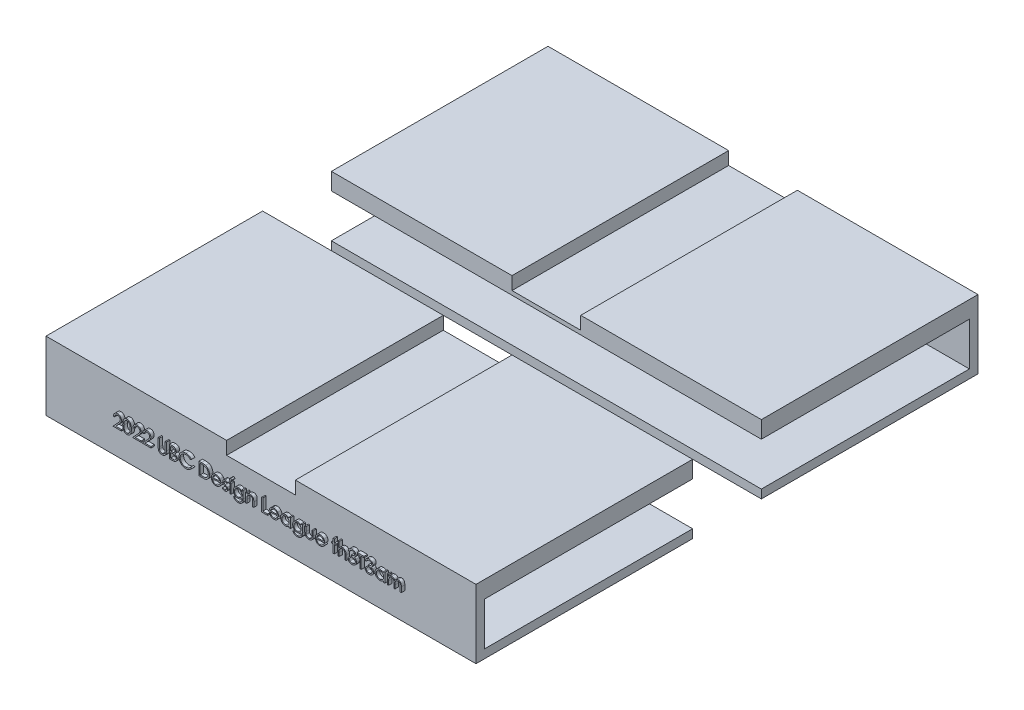
from build123d import *

# Parameters (mm, degrees)
SKETCH1_W               = 250.2
SKETCH1_H               = 292.1
BOSS_EXTRUDE1_DEPTH     = 40
SKETCH2_W               = 40
SKETCH2_H               = 7.53
CUT_EXTRUDE1_DEPTH      = 387.681328745
CUT_EXTRUDE3_DEPTH      = 387.681328745
CUT_EXTRUDE3_DEPTH_BACK = 387.681328745
SKETCH4_W               = 0.664850427
SKETCH4_H               = 5.413782051
BOSS_EXTRUDE2_DEPTH     = 2


with BuildPart() as part:
    # Sketch1 → Boss-Extrude1 (new body)
    with BuildSketch(Plane(origin=(0, 0, 0), x_dir=(1, 0, 0), z_dir=(0, 1, 0))):
        with Locations((125.1, 146.05)):
            Rectangle(SKETCH1_W, SKETCH1_H)
    extrude(amount=BOSS_EXTRUDE1_DEPTH)

    # Sketch2 → Cut-Extrude1 (cut, through all)
    with BuildSketch(Plane.XY):
        with Locations((125.1, 36.235)):
            Rectangle(SKETCH2_W, SKETCH2_H)
    extrude(amount=-CUT_EXTRUDE1_DEPTH, mode=Mode.SUBTRACT)

    # Sketch3 → Cut-Extrude3 (cut, two sides: drawn at the far end of the back side and taken through both)
    with BuildSketch(Plane(origin=(250.2, 0, 0), x_dir=(0, 0, -1), z_dir=(1, 0, 0)).offset(-CUT_EXTRUDE3_DEPTH_BACK)):
        Polygon((5, 30.105572061), (126.05, 30.105572061), (126.05, 40), (166.05, 40), (166.05, 30.105572061), (287.1, 30.105572061), (287.1, 5), (166.05, 5), (166.05, 0), (126.05, 0), (126.05, 5), (5, 5), align=None)
    extrude(amount=CUT_EXTRUDE3_DEPTH + CUT_EXTRUDE3_DEPTH_BACK, mode=Mode.SUBTRACT)


with BuildPart() as cut_extrude3_piece_1:
    # of the separate pieces the step leaves, piece 1, a body of its own (cut_extrude3_pieces)
    add(part.part.solids().sort_by_distance((0, 0, 0))[0])

    # Sketch4 → Boss-Extrude2 (add)
    # profile 1 of 27: a face of its own
    with BuildSketch(Plane.XY):
        with BuildLine():
            Line((41.898717949, 21.244992157), (41.233867521, 21.244992157))
            add(Edge.make_bspline(
                [(41.233867521, 21.244992157), (41.238200662, 21.333195536), (41.246710835, 21.506424625), (41.286564047, 21.75899356), (41.343588904, 22.000409551), (41.424215815, 22.228734202), (41.524347436, 22.445986344), (41.644425994, 22.651303044), (41.786652977, 22.84390106), (41.947957231, 23.021994945), (42.12315085, 23.185375303), (42.312181756, 23.326462234), (42.510820397, 23.445667971), (42.718464125, 23.545323267), (42.937455651, 23.62012594), (43.1658077, 23.675628411), (43.404523539, 23.709021676), (43.567168252, 23.712611089), (43.649886485, 23.714436601)],
                knots=[0, 0, 0, 0, 1.10065271, 2.161652631, 3.183658789, 4.190468796, 5.17591951, 6.163126047, 7.15150782, 8.156236427, 9.156009102, 10.134482811, 11.092018607, 12.041330605, 13.001268258, 13.972401359, 14.968799086, 16, 16, 16, 16], degree=3))
            add(Edge.make_bspline(
                [(43.649886485, 23.714436601), (43.731120075, 23.712534868), (43.890741178, 23.708798031), (44.123705775, 23.676707186), (44.345484382, 23.626445684), (44.555643488, 23.555928052), (44.752506324, 23.461134348), (44.937551769, 23.347262891), (45.112982818, 23.215564248), (45.27090051, 23.060510343), (45.415909278, 22.894981962), (45.541009051, 22.7182659), (45.648140247, 22.535747245), (45.737437503, 22.346034218), (45.803172997, 22.147340541), (45.853080204, 21.942558962), (45.881289896, 21.729569779), (45.885619376, 21.585410903), (45.887820513, 21.51211956)],
                knots=[0, 0, 0, 0, 1.111607364, 2.184268762, 3.212621178, 4.221274766, 5.211760367, 6.196651075, 7.1921475, 8.207485113, 9.220403448, 10.201281604, 11.166441695, 12.114753415, 13.065576456, 14.026450734, 14.996634279, 16, 16, 16, 16], degree=3))
            add(Edge.make_bspline(
                [(45.887820513, 21.51211956), (45.88423644, 21.408936644), (45.877131189, 21.204381525), (45.816352425, 20.903783399), (45.72142731, 20.612543995), (45.607132905, 20.378150039), (45.491832898, 20.189272477), (45.387931007, 20.033763718), (45.266297157, 19.86632381), (45.125161003, 19.687513446), (44.96744209, 19.49593203), (44.791711845, 19.291695297), (44.596717141, 19.076913384), (44.459856648, 18.930216528), (44.388938969, 18.854201892)],
                knots=[0, 0, 0, 0, 1.184426356, 2.348067706, 3.509069118, 4.696110526, 5.333549288, 6.050745305, 6.844228056, 7.710549037, 8.667450064, 9.695053472, 10.805634456, 12, 12, 12, 12], degree=3))
            Line((44.388938969, 18.854201892), (42.535371595, 16.875975063))
            Line((42.535371595, 16.875975063), (45.982799145, 16.875975063))
            Line((45.982799145, 16.875975063), (45.982799145, 16.116146003))
            Line((45.982799145, 16.116146003), (40.948931624, 16.116146003))
            Line((40.948931624, 16.116146003), (43.822035256, 19.182174982))
            add(Edge.make_bspline(
                [(43.822035256, 19.182174982), (43.891986617, 19.255196398), (44.026348864, 19.395455593), (44.216388652, 19.600228192), (44.38707451, 19.790198053), (44.539511325, 19.965006247), (44.670392245, 20.127209733), (44.786538469, 20.271555188), (44.87959897, 20.404385442), (44.980596558, 20.558353074), (45.078416151, 20.746339146), (45.162473972, 20.976068788), (45.213728734, 21.21255814), (45.219877303, 21.372370785), (45.222970085, 21.452757915)],
                knots=[0, 0, 0, 0, 1.329631726, 2.553950428, 3.673215718, 4.687767853, 5.603093632, 6.413772471, 7.123043292, 7.734684054, 8.834405432, 9.900288307, 10.943827018, 12, 12, 12, 12], degree=3))
            add(Edge.make_bspline(
                [(45.222970085, 21.452757915), (45.221624431, 21.503306875), (45.218972404, 21.602929168), (45.195566945, 21.748991358), (45.160196373, 21.889886881), (45.109512244, 22.026049125), (45.042611311, 22.156109088), (44.96117599, 22.280225088), (44.867217022, 22.400216731), (44.758523502, 22.512724545), (44.639119119, 22.61576643), (44.512977957, 22.707045744), (44.379521903, 22.783328529), (44.239313644, 22.845862264), (44.092744067, 22.894916821), (43.93952969, 22.928907481), (43.780093856, 22.950248739), (43.67122629, 22.953136236), (43.615753539, 22.954607541)],
                knots=[0, 0, 0, 0, 0.991446411, 1.95395049, 2.89581595, 3.838931463, 4.798493298, 5.75982156, 6.748411868, 7.785213223, 8.824556874, 9.840280684, 10.836137867, 11.835679398, 12.848801643, 13.863922112, 14.911575587, 16, 16, 16, 16], degree=3))
            add(Edge.make_bspline(
                [(43.615753539, 22.954607541), (43.55781861, 22.953094056), (43.444043974, 22.950121822), (43.276998688, 22.929330516), (43.117643792, 22.893461821), (42.965578431, 22.844404527), (42.820545308, 22.782050598), (42.683249748, 22.704386405), (42.553999965, 22.611711345), (42.432552991, 22.506638834), (42.320657569, 22.389655745), (42.222345015, 22.25924799), (42.136442185, 22.117796627), (42.061492641, 21.965683328), (42.00062643, 21.801527827), (41.954116595, 21.625912852), (41.917314436, 21.439600928), (41.905019734, 21.310939165), (41.898717949, 21.244992157)],
                knots=[0, 0, 0, 0, 1.031018746, 2.02475058, 2.990194455, 3.934040569, 4.864654155, 5.795059489, 6.735614925, 7.690564532, 8.649604399, 9.611025574, 10.590972636, 11.591080095, 12.624614302, 13.701020113, 14.821632451, 16, 16, 16, 16], degree=3))
        make_face()
    # profile 2 of 27: a face of its own
    with BuildSketch(Plane.XY):
        with BuildLine():
            add(Edge.make_bspline(
                [(46.647649573, 19.817344587), (46.648343878, 19.936084058), (46.649692575, 20.166737191), (46.6646964, 20.50283135), (46.689620874, 20.818130629), (46.723778314, 21.112650118), (46.765345372, 21.386465853), (46.820834818, 21.638846089), (46.883938584, 21.870958923), (46.957074594, 22.083561259), (47.039598748, 22.279517397), (47.129417933, 22.46245074), (47.230096748, 22.632084497), (47.335881213, 22.791126153), (47.451053432, 22.936972307), (47.572335871, 23.071682609), (47.704462176, 23.192143698), (47.842940877, 23.301885038), (47.989025727, 23.39808642), (48.138552703, 23.482822383), (48.292551011, 23.555212102), (48.451441098, 23.612130191), (48.613794845, 23.65914315), (48.780179803, 23.69129309), (48.95087069, 23.711521879), (49.066083894, 23.713455809), (49.124514223, 23.714436601)],
                knots=[0, 0, 0, 0, 1.646270934, 3.197905019, 4.663502075, 6.030701355, 7.308322542, 8.50163776, 9.611534131, 10.641858119, 11.616356847, 12.558055219, 13.465016945, 14.349605745, 15.204443733, 16.039544428, 16.859896111, 17.680448484, 18.487036065, 19.28249412, 20.06191084, 20.843045899, 21.620316918, 22.403196591, 23.190181807, 24, 24, 24, 24], degree=3))
            add(Edge.make_bspline(
                [(49.124514223, 23.714436601), (49.183432652, 23.713404059), (49.300602871, 23.711350657), (49.473831665, 23.691614979), (49.643058492, 23.658867769), (49.807561885, 23.612468372), (49.968693107, 23.55490419), (50.125191836, 23.482753126), (50.278030159, 23.39876619), (50.424779267, 23.300078983), (50.567050203, 23.190049831), (50.701348392, 23.065668849), (50.827686057, 22.928191943), (50.947648786, 22.779089998), (51.057833134, 22.615503235), (51.162763565, 22.440276869), (51.256684375, 22.250346539), (51.347139437, 22.048881215), (51.425216892, 21.830306471), (51.495630445, 21.595854394), (51.552524262, 21.342755699), (51.599914888, 21.072338313), (51.636628251, 20.78360914), (51.663367344, 20.477187106), (51.67749204, 20.152870612), (51.680152058, 19.931133165), (51.681517094, 19.817344587)],
                knots=[0, 0, 0, 0, 0.810914788, 1.612654377, 2.396697861, 3.181598691, 3.963628158, 4.749916497, 5.551656086, 6.361998678, 7.18212741, 8.025565596, 8.878627764, 9.750805457, 10.657531673, 11.591944965, 12.560506719, 13.57287815, 14.630710178, 15.753379473, 16.941251878, 18.199788006, 19.531962791, 20.947069417, 22.433333509, 24, 24, 24, 24], degree=3))
            add(Edge.make_bspline(
                [(51.681517094, 19.817344587), (51.680137907, 19.704052315), (51.677450617, 19.483306944), (51.663525687, 19.160449713), (51.636096585, 18.855653854), (51.601785443, 18.568188376), (51.554264238, 18.299249749), (51.495833302, 18.047907333), (51.430956786, 17.813075715), (51.350873138, 17.596678697), (51.263220468, 17.39569755), (51.167853636, 17.208018753), (51.065682504, 17.031983433), (50.954369661, 16.869000636), (50.835723269, 16.717915812), (50.70720395, 16.581395844), (50.572434545, 16.456151255), (50.429744931, 16.34470531), (50.280707148, 16.24715914), (50.128393768, 16.159923157), (49.970102273, 16.089580619), (49.809419857, 16.029181449), (49.644048149, 15.983037159), (49.474193288, 15.951130831), (49.300719256, 15.928753752), (49.183452609, 15.927046703), (49.124514223, 15.926188738)],
                knots=[0, 0, 0, 0, 1.561518951, 3.042555995, 4.452378317, 5.7783523, 7.031515105, 8.214008947, 9.334062868, 10.386615937, 11.391082383, 12.354592575, 13.286541444, 14.194233754, 15.072674879, 15.931287219, 16.775624067, 17.606195743, 18.42308326, 19.229000347, 20.022332153, 20.807536673, 21.593273796, 22.3848459, 23.188221202, 24, 24, 24, 24], degree=3))
            add(Edge.make_bspline(
                [(49.124514223, 15.926188738), (49.066085515, 15.927175857), (48.950875507, 15.929122263), (48.780161207, 15.949259661), (48.614463368, 15.981635143), (48.452964339, 16.026966955), (48.294835549, 16.082455025), (48.142231742, 16.154746989), (47.993456145, 16.238004101), (47.848905684, 16.332821077), (47.71129661, 16.441451973), (47.579854562, 16.561603051), (47.457881605, 16.696272604), (47.344356103, 16.843334208), (47.23646095, 17.001434905), (47.137211776, 17.172733294), (47.045410135, 17.356550153), (46.96149808, 17.554073064), (46.887100075, 17.768184328), (46.821382426, 18.001333423), (46.769494126, 18.255578186), (46.725080204, 18.528876613), (46.689256927, 18.822403099), (46.664800272, 19.136316996), (46.649684488, 19.470422688), (46.648340256, 19.69959371), (46.647649573, 19.817344587)],
                knots=[0, 0, 0, 0, 0.810891512, 1.598919785, 2.382837074, 3.152667961, 3.926044502, 4.706494248, 5.493654104, 6.291793342, 7.103789334, 7.925228297, 8.761435821, 9.622817696, 10.50288917, 11.416980706, 12.369136599, 13.353924996, 14.394355917, 15.514179734, 16.714354668, 17.994756427, 19.357759367, 20.818452758, 22.365282078, 24, 24, 24, 24], degree=3))
        make_face()
        with BuildLine():
            add(Edge.make_bspline(
                [(47.3125, 19.820312669), (47.31275283, 19.721361257), (47.313243522, 19.529315995), (47.32606248, 19.25024776), (47.343525471, 18.989960564), (47.36604955, 18.748123912), (47.399499125, 18.525556385), (47.436978492, 18.320727223), (47.482588615, 18.134720404), (47.53655307, 17.966259538), (47.598019158, 17.812485676), (47.665129903, 17.669396438), (47.7372251, 17.535301506), (47.817910635, 17.411405368), (47.905784186, 17.297303987), (47.998860917, 17.190977825), (48.100614554, 17.096157548), (48.241380809, 16.982435705), (48.42721668, 16.864920205), (48.66136331, 16.762587649), (48.901961531, 16.698278116), (49.065265011, 16.690099832), (49.14677484, 16.686017798)],
                knots=[0, 0, 0, 0, 1.459021318, 2.831673884, 4.118529203, 5.306027144, 6.411944654, 7.436330062, 8.375795394, 9.233974572, 10.042671642, 10.816086306, 11.563610507, 12.285937304, 12.993564865, 13.685989202, 14.367179055, 15.041617293, 16.353048772, 17.594441528, 18.799311195, 20, 20, 20, 20], degree=3))
            add(Edge.make_bspline(
                [(49.14677484, 16.686017798), (49.228811911, 16.689399767), (49.392716679, 16.696156723), (49.632183212, 16.761347384), (49.864657284, 16.859707909), (50.04684289, 16.976013462), (50.185447608, 17.086775093), (50.284755237, 17.181209432), (50.375903239, 17.286949351), (50.462352298, 17.401036194), (50.541640674, 17.525649619), (50.613740983, 17.660190403), (50.679534068, 17.805032163), (50.717018215, 17.906144778), (50.736182893, 17.957841048)],
                knots=[0, 0, 0, 0, 1.353760809, 2.704726607, 4.075137775, 5.516104923, 6.260822281, 7.007110065, 7.778089737, 8.566572457, 9.372053459, 10.217411131, 11.088608312, 12, 12, 12, 12], degree=3))
            add(Edge.make_bspline(
                [(50.736182893, 17.957841048), (50.758517468, 18.023943997), (50.803866234, 18.158161331), (50.862311156, 18.366364395), (50.908338918, 18.584810245), (50.949748042, 18.812193409), (50.97801201, 19.050190776), (51.000761548, 19.298065955), (51.014161502, 19.556005838), (51.015822559, 19.731255236), (51.016666667, 19.820312669)],
                knots=[0, 0, 0, 0, 0.884706709, 1.796334032, 2.740027952, 3.714592787, 4.726048262, 5.777819803, 6.87074269, 8, 8, 8, 8], degree=3))
            add(Edge.make_bspline(
                [(51.016666667, 19.820312669), (51.015502099, 19.909355698), (51.013223957, 20.083542897), (51.004516016, 20.338639712), (50.98202945, 20.580929806), (50.957054649, 20.811456973), (50.920230531, 21.028945114), (50.880526506, 21.235214927), (50.82718394, 21.427710996), (50.77020375, 21.609447111), (50.704988413, 21.778358496), (50.633200108, 21.935232677), (50.556530719, 22.080827011), (50.47325631, 22.214742038), (50.384365448, 22.337577587), (50.287511969, 22.446870812), (50.186537713, 22.546009061), (50.045108003, 22.659171499), (49.859954089, 22.774554588), (49.629564136, 22.88073878), (49.389807939, 22.941716332), (49.227727461, 22.95031357), (49.14677484, 22.954607541)],
                knots=[0, 0, 0, 0, 1.31362396, 2.569729283, 3.763502607, 4.902122613, 5.988968491, 7.01645872, 7.998833611, 8.933434873, 9.825090667, 10.667526885, 11.477055099, 12.250526234, 12.991942729, 13.710640831, 14.402115721, 15.076753259, 16.378508321, 17.609869233, 18.806226677, 20, 20, 20, 20], degree=3))
            add(Edge.make_bspline(
                [(49.14677484, 22.954607541), (49.06483742, 22.950307646), (48.90081331, 22.941700022), (48.658565139, 22.880965968), (48.426357594, 22.77510519), (48.241693298, 22.658789335), (48.10016495, 22.548006576), (48.000506582, 22.451938582), (47.907063851, 22.34685401), (47.820983886, 22.23170329), (47.74036157, 22.107951596), (47.666318426, 21.974625377), (47.599606745, 21.83104899), (47.538044477, 21.677344201), (47.483915409, 21.508897869), (47.43926652, 21.323120166), (47.398018924, 21.118942495), (47.368818939, 20.895169536), (47.342860656, 20.653272312), (47.326178469, 20.392335322), (47.313200641, 20.11279905), (47.312738225, 19.919760831), (47.3125, 19.820312669)],
                knots=[0, 0, 0, 0, 1.207732386, 2.417664972, 3.655092373, 4.956220595, 5.625982001, 6.301752483, 6.994047911, 7.697131622, 8.419323945, 9.170223765, 9.943494443, 10.752040957, 11.610060368, 12.549350801, 13.567764191, 14.679664412, 15.874934091, 17.154273443, 18.533957287, 20, 20, 20, 20], degree=3))
        make_face(mode=Mode.SUBTRACT)
    # profile 3 of 27: a face of its own
    with BuildSketch(Plane.XY):
        with BuildLine():
            Line((53.296153846, 21.244992157), (52.631303419, 21.244992157))
            add(Edge.make_bspline(
                [(52.631303419, 21.244992157), (52.635636559, 21.333195536), (52.644146732, 21.506424625), (52.683999944, 21.75899356), (52.741024801, 22.000409551), (52.821651712, 22.228734202), (52.921783333, 22.445986344), (53.041861891, 22.651303044), (53.184088875, 22.84390106), (53.345393129, 23.021994945), (53.520586748, 23.185375303), (53.709617653, 23.326462234), (53.908256294, 23.445667971), (54.115900022, 23.545323267), (54.334891548, 23.62012594), (54.563243597, 23.675628411), (54.801959436, 23.709021676), (54.964604149, 23.712611089), (55.047322382, 23.714436601)],
                knots=[0, 0, 0, 0, 1.10065271, 2.161652631, 3.183658789, 4.190468796, 5.17591951, 6.163126047, 7.15150782, 8.156236427, 9.156009102, 10.134482811, 11.092018607, 12.041330605, 13.001268258, 13.972401359, 14.968799086, 16, 16, 16, 16], degree=3))
            add(Edge.make_bspline(
                [(55.047322382, 23.714436601), (55.128555973, 23.712534868), (55.288177075, 23.708798031), (55.521141673, 23.676707186), (55.742920279, 23.626445684), (55.953079385, 23.555928052), (56.149942222, 23.461134348), (56.334987666, 23.347262891), (56.510418716, 23.215564248), (56.668336408, 23.060510343), (56.813345175, 22.894981962), (56.938444949, 22.7182659), (57.045576145, 22.535747245), (57.134873401, 22.346034218), (57.200608895, 22.147340541), (57.250516102, 21.942558962), (57.278725794, 21.729569779), (57.283055274, 21.585410903), (57.28525641, 21.51211956)],
                knots=[0, 0, 0, 0, 1.111607364, 2.184268762, 3.212621178, 4.221274766, 5.211760367, 6.196651075, 7.1921475, 8.207485113, 9.220403448, 10.201281604, 11.166441695, 12.114753415, 13.065576456, 14.026450734, 14.996634279, 16, 16, 16, 16], degree=3))
            add(Edge.make_bspline(
                [(57.28525641, 21.51211956), (57.281672337, 21.408936644), (57.274567087, 21.204381525), (57.213788323, 20.903783399), (57.118863208, 20.612543995), (57.004568802, 20.378150039), (56.889268796, 20.189272477), (56.785366905, 20.033763718), (56.663733055, 19.86632381), (56.522596901, 19.687513446), (56.364877988, 19.49593203), (56.189147742, 19.291695297), (55.994153039, 19.076913384), (55.857292545, 18.930216528), (55.786374866, 18.854201892)],
                knots=[0, 0, 0, 0, 1.184426356, 2.348067706, 3.509069118, 4.696110526, 5.333549288, 6.050745305, 6.844228056, 7.710549037, 8.667450064, 9.695053472, 10.805634456, 12, 12, 12, 12], degree=3))
            Line((55.786374866, 18.854201892), (53.932807492, 16.875975063))
            Line((53.932807492, 16.875975063), (57.380235043, 16.875975063))
            Line((57.380235043, 16.875975063), (57.380235043, 16.116146003))
            Line((57.380235043, 16.116146003), (52.346367521, 16.116146003))
            Line((52.346367521, 16.116146003), (55.219471154, 19.182174982))
            add(Edge.make_bspline(
                [(55.219471154, 19.182174982), (55.289422514, 19.255196398), (55.423784762, 19.395455593), (55.613824549, 19.600228192), (55.784510408, 19.790198053), (55.936947223, 19.965006247), (56.067828142, 20.127209733), (56.183974367, 20.271555188), (56.277034867, 20.404385442), (56.378032455, 20.558353074), (56.475852049, 20.746339146), (56.559909869, 20.976068788), (56.611164632, 21.21255814), (56.6173132, 21.372370785), (56.620405983, 21.452757915)],
                knots=[0, 0, 0, 0, 1.329631726, 2.553950428, 3.673215718, 4.687767853, 5.603093632, 6.413772471, 7.123043292, 7.734684054, 8.834405432, 9.900288307, 10.943827018, 12, 12, 12, 12], degree=3))
            add(Edge.make_bspline(
                [(56.620405983, 21.452757915), (56.619060328, 21.503306875), (56.616408302, 21.602929168), (56.593002842, 21.748991358), (56.557632271, 21.889886881), (56.506948141, 22.026049125), (56.440047208, 22.156109088), (56.358611887, 22.280225088), (56.26465292, 22.400216731), (56.1559594, 22.512724545), (56.036555016, 22.61576643), (55.910413854, 22.707045744), (55.7769578, 22.783328529), (55.636749542, 22.845862264), (55.490179965, 22.894916821), (55.336965588, 22.928907481), (55.177529753, 22.950248739), (55.068662187, 22.953136236), (55.013189436, 22.954607541)],
                knots=[0, 0, 0, 0, 0.991446411, 1.95395049, 2.89581595, 3.838931463, 4.798493298, 5.75982156, 6.748411868, 7.785213223, 8.824556874, 9.840280684, 10.836137867, 11.835679398, 12.848801643, 13.863922112, 14.911575587, 16, 16, 16, 16], degree=3))
            add(Edge.make_bspline(
                [(55.013189436, 22.954607541), (54.955254507, 22.953094056), (54.841479872, 22.950121822), (54.674434585, 22.929330516), (54.51507969, 22.893461821), (54.363014328, 22.844404527), (54.217981205, 22.782050598), (54.080685645, 22.704386405), (53.951435863, 22.611711345), (53.829988889, 22.506638834), (53.718093466, 22.389655745), (53.619780912, 22.25924799), (53.533878082, 22.117796627), (53.458928538, 21.965683328), (53.398062327, 21.801527827), (53.351552492, 21.625912852), (53.314750333, 21.439600928), (53.302455632, 21.310939165), (53.296153846, 21.244992157)],
                knots=[0, 0, 0, 0, 1.031018746, 2.02475058, 2.990194455, 3.934040569, 4.864654155, 5.795059489, 6.735614925, 7.690564532, 8.649604399, 9.611025574, 10.590972636, 11.591080095, 12.624614302, 13.701020113, 14.821632451, 16, 16, 16, 16], degree=3))
        make_face()
    # profile 4 of 27: a face of its own
    with BuildSketch(Plane.XY):
        with BuildLine():
            Line((58.994871795, 21.244992157), (58.330021368, 21.244992157))
            add(Edge.make_bspline(
                [(58.330021368, 21.244992157), (58.334354508, 21.333195536), (58.342864681, 21.506424625), (58.382717893, 21.75899356), (58.43974275, 22.000409551), (58.520369661, 22.228734202), (58.620501282, 22.445986344), (58.74057984, 22.651303044), (58.882806824, 22.84390106), (59.044111077, 23.021994945), (59.219304697, 23.185375303), (59.408335602, 23.326462234), (59.606974243, 23.445667971), (59.814617971, 23.545323267), (60.033609497, 23.62012594), (60.261961546, 23.675628411), (60.500677385, 23.709021676), (60.663322098, 23.712611089), (60.746040331, 23.714436601)],
                knots=[0, 0, 0, 0, 1.10065271, 2.161652631, 3.183658789, 4.190468796, 5.17591951, 6.163126047, 7.15150782, 8.156236427, 9.156009102, 10.134482811, 11.092018607, 12.041330605, 13.001268258, 13.972401359, 14.968799086, 16, 16, 16, 16], degree=3))
            add(Edge.make_bspline(
                [(60.746040331, 23.714436601), (60.827273921, 23.712534868), (60.986895024, 23.708798031), (61.219859621, 23.676707186), (61.441638228, 23.626445684), (61.651797334, 23.555928052), (61.848660171, 23.461134348), (62.033705615, 23.347262891), (62.209136664, 23.215564248), (62.367054356, 23.060510343), (62.512063124, 22.894981962), (62.637162897, 22.7182659), (62.744294093, 22.535747245), (62.833591349, 22.346034218), (62.899326843, 22.147340541), (62.94923405, 21.942558962), (62.977443743, 21.729569779), (62.981773222, 21.585410903), (62.983974359, 21.51211956)],
                knots=[0, 0, 0, 0, 1.111607364, 2.184268762, 3.212621178, 4.221274766, 5.211760367, 6.196651075, 7.1921475, 8.207485113, 9.220403448, 10.201281604, 11.166441695, 12.114753415, 13.065576456, 14.026450734, 14.996634279, 16, 16, 16, 16], degree=3))
            add(Edge.make_bspline(
                [(62.983974359, 21.51211956), (62.980390286, 21.408936644), (62.973285035, 21.204381525), (62.912506272, 20.903783399), (62.817581156, 20.612543995), (62.703286751, 20.378150039), (62.587986744, 20.189272477), (62.484084853, 20.033763718), (62.362451003, 19.86632381), (62.221314849, 19.687513446), (62.063595937, 19.49593203), (61.887865691, 19.291695297), (61.692870987, 19.076913384), (61.556010494, 18.930216528), (61.485092815, 18.854201892)],
                knots=[0, 0, 0, 0, 1.184426356, 2.348067706, 3.509069118, 4.696110526, 5.333549288, 6.050745305, 6.844228056, 7.710549037, 8.667450064, 9.695053472, 10.805634456, 12, 12, 12, 12], degree=3))
            Line((61.485092815, 18.854201892), (59.631525441, 16.875975063))
            Line((59.631525441, 16.875975063), (63.078952991, 16.875975063))
            Line((63.078952991, 16.875975063), (63.078952991, 16.116146003))
            Line((63.078952991, 16.116146003), (58.04508547, 16.116146003))
            Line((58.04508547, 16.116146003), (60.918189103, 19.182174982))
            add(Edge.make_bspline(
                [(60.918189103, 19.182174982), (60.988140463, 19.255196398), (61.12250271, 19.395455593), (61.312542498, 19.600228192), (61.483228357, 19.790198053), (61.635665171, 19.965006247), (61.766546091, 20.127209733), (61.882692315, 20.271555188), (61.975752816, 20.404385442), (62.076750404, 20.558353074), (62.174569998, 20.746339146), (62.258627818, 20.976068788), (62.30988258, 21.21255814), (62.316031149, 21.372370785), (62.319123932, 21.452757915)],
                knots=[0, 0, 0, 0, 1.329631726, 2.553950428, 3.673215718, 4.687767853, 5.603093632, 6.413772471, 7.123043292, 7.734684054, 8.834405432, 9.900288307, 10.943827018, 12, 12, 12, 12], degree=3))
            add(Edge.make_bspline(
                [(62.319123932, 21.452757915), (62.317778277, 21.503306875), (62.31512625, 21.602929168), (62.291720791, 21.748991358), (62.256350219, 21.889886881), (62.20566609, 22.026049125), (62.138765157, 22.156109088), (62.057329836, 22.280225088), (61.963370868, 22.400216731), (61.854677348, 22.512724545), (61.735272965, 22.61576643), (61.609131803, 22.707045744), (61.475675749, 22.783328529), (61.33546749, 22.845862264), (61.188897914, 22.894916821), (61.035683536, 22.928907481), (60.876247702, 22.950248739), (60.767380136, 22.953136236), (60.711907385, 22.954607541)],
                knots=[0, 0, 0, 0, 0.991446411, 1.95395049, 2.89581595, 3.838931463, 4.798493298, 5.75982156, 6.748411868, 7.785213223, 8.824556874, 9.840280684, 10.836137867, 11.835679398, 12.848801643, 13.863922112, 14.911575587, 16, 16, 16, 16], degree=3))
            add(Edge.make_bspline(
                [(60.711907385, 22.954607541), (60.653972456, 22.953094056), (60.54019782, 22.950121822), (60.373152534, 22.929330516), (60.213797638, 22.893461821), (60.061732277, 22.844404527), (59.916699154, 22.782050598), (59.779403594, 22.704386405), (59.650153812, 22.611711345), (59.528706837, 22.506638834), (59.416811415, 22.389655745), (59.318498861, 22.25924799), (59.232596031, 22.117796627), (59.157646487, 21.965683328), (59.096780276, 21.801527827), (59.050270441, 21.625912852), (59.013468282, 21.439600928), (59.00117358, 21.310939165), (58.994871795, 21.244992157)],
                knots=[0, 0, 0, 0, 1.031018746, 2.02475058, 2.990194455, 3.934040569, 4.864654155, 5.795059489, 6.735614925, 7.690564532, 8.649604399, 9.611025574, 10.590972636, 11.591080095, 12.624614302, 13.701020113, 14.821632451, 16, 16, 16, 16], degree=3))
        make_face()
    # profile 5 of 27: a face of its own
    with BuildSketch(Plane.XY):
        with BuildLine():
            Line((67.258012821, 23.524479336), (67.922863248, 23.524479336))
            Line((67.922863248, 23.524479336), (67.922863248, 19.085712309))
            add(Edge.make_bspline(
                [(67.922863248, 19.085712309), (67.922764306, 19.022888085), (67.922576548, 18.903668293), (67.923830702, 18.733978724), (67.927343032, 18.583118686), (67.929557403, 18.450506667), (67.934483593, 18.336751184), (67.938501125, 18.241235943), (67.94366697, 18.164413215), (67.949875402, 18.119580255), (67.952544071, 18.100308997)],
                knots=[0, 0, 0, 0, 1.528628734, 2.90083645, 4.128790002, 5.200304208, 6.127813768, 6.898992206, 7.526736466, 8, 8, 8, 8], degree=3))
            add(Edge.make_bspline(
                [(67.952544071, 18.100308997), (67.963503025, 18.030783348), (67.984803436, 17.895649571), (68.039088269, 17.703227041), (68.114901979, 17.529805455), (68.204739753, 17.369973222), (68.323130447, 17.228179076), (68.464954597, 17.097556078), (68.636780874, 16.983315758), (68.827832489, 16.87885654), (69.033752908, 16.794898782), (69.244173422, 16.731412827), (69.455931061, 16.69272249), (69.597697277, 16.688242482), (69.66809562, 16.686017798)],
                knots=[0, 0, 0, 0, 1.035780045, 2.013197591, 2.933192213, 3.817615948, 4.702609284, 5.640816605, 6.646850145, 7.73207398, 8.84249596, 9.914020372, 10.964143139, 12, 12, 12, 12], degree=3))
            add(Edge.make_bspline(
                [(69.66809562, 16.686017798), (69.72853437, 16.688290781), (69.849062793, 16.692823619), (70.028146404, 16.720893648), (70.202559968, 16.771483178), (70.37316474, 16.836760667), (70.533080991, 16.923009735), (70.682397943, 17.022643012), (70.815671604, 17.139506033), (70.937291032, 17.268835095), (71.043198313, 17.414757672), (71.135000563, 17.574096397), (71.210197114, 17.749249182), (71.247330908, 17.872342709), (71.266407919, 17.935580431)],
                knots=[0, 0, 0, 0, 0.994687771, 1.983630487, 2.973142513, 3.978332533, 4.983357753, 5.956394766, 6.925816176, 7.893390482, 8.871859704, 9.88551698, 10.913711441, 12, 12, 12, 12], degree=3))
            add(Edge.make_bspline(
                [(71.266407919, 17.935580431), (71.272758185, 17.961718247), (71.286909135, 18.019963834), (71.300132046, 18.118433899), (71.313904192, 18.234616386), (71.323460032, 18.369346056), (71.332775948, 18.522171448), (71.338349286, 18.693888693), (71.340925339, 18.88387426), (71.341693012, 19.016456253), (71.342094017, 19.085712309)],
                knots=[0, 0, 0, 0, 0.558680831, 1.244966039, 2.062412453, 2.990489873, 4.051219941, 5.244515665, 6.560634259, 8, 8, 8, 8], degree=3))
            Line((71.342094017, 19.085712309), (71.342094017, 23.524479336))
            Line((71.342094017, 23.524479336), (72.006944444, 23.524479336))
            Line((72.006944444, 23.524479336), (72.006944444, 19.050095322))
            add(Edge.make_bspline(
                [(72.006944444, 19.050095322), (72.006406556, 18.969453753), (72.005356835, 18.812076828), (71.996253948, 18.581463118), (71.981739965, 18.362699308), (71.961233512, 18.15575599), (71.934061855, 17.961373687), (71.903845972, 17.777848594), (71.86536596, 17.606498093), (71.820421928, 17.445986142), (71.769042918, 17.293193472), (71.702492487, 17.148183571), (71.627510629, 17.006548092), (71.538579614, 16.870429261), (71.438648854, 16.739224391), (71.325509463, 16.613729182), (71.202903322, 16.491938201), (71.068792254, 16.376975544), (70.925386976, 16.271547178), (70.773114066, 16.178841896), (70.613143236, 16.100475239), (70.445890319, 16.035967865), (70.27128394, 15.987465297), (70.089319695, 15.951322884), (69.899583403, 15.930786354), (69.770541547, 15.927734269), (69.705196648, 15.926188738)],
                knots=[0, 0, 0, 0, 1.316592851, 2.569410997, 3.76748051, 4.895814652, 5.963796859, 6.97159953, 7.931736103, 8.829262218, 9.692595152, 10.560224239, 11.431080259, 12.30701507, 13.211635791, 14.121146779, 15.063487852, 16.031507147, 17.00238618, 17.966455255, 18.938106653, 19.907068911, 20.888905087, 21.893141452, 22.933117798, 24, 24, 24, 24], degree=3))
            add(Edge.make_bspline(
                [(69.705196648, 15.926188738), (69.633930381, 15.927849824), (69.494106219, 15.93110887), (69.288073977, 15.949783691), (69.090558928, 15.984959292), (68.899474989, 16.02974784), (68.71742367, 16.091520084), (68.541965879, 16.163694448), (68.376106671, 16.252334649), (68.217155315, 16.350957331), (68.069359581, 16.461922815), (67.933686745, 16.582869517), (67.809912819, 16.711859982), (67.700124078, 16.850290756), (67.602501539, 16.997085203), (67.518405921, 17.152658594), (67.446199554, 17.316950696), (67.40893232, 17.431151637), (67.390092481, 17.48888405)],
                knots=[0, 0, 0, 0, 1.13879206, 2.234305948, 3.301075583, 4.341971843, 5.366689343, 6.369221514, 7.369726634, 8.367512178, 9.355451585, 10.318319045, 11.268648973, 12.207971039, 13.137398894, 14.081662264, 15.030215811, 16, 16, 16, 16], degree=3))
            add(Edge.make_bspline(
                [(67.390092481, 17.48888405), (67.379134163, 17.528323), (67.355365327, 17.613866959), (67.32991178, 17.75544336), (67.308514224, 17.918458269), (67.288394126, 18.102922844), (67.276521832, 18.308980062), (67.266113253, 18.5365406), (67.257939493, 18.785879619), (67.257987695, 18.959561677), (67.258012821, 19.050095322)],
                knots=[0, 0, 0, 0, 0.625038921, 1.35572334, 2.194682327, 3.136881307, 4.189498639, 5.346923369, 6.617055217, 8, 8, 8, 8], degree=3))
            Line((67.258012821, 19.050095322), (67.258012821, 23.524479336))
        make_face()
    # profile 6 of 27: a face of its own
    with BuildSketch(Plane.XY):
        with BuildLine():
            Line((73.906517094, 23.524479336), (75.351973157, 23.524479336))
            add(Edge.make_bspline(
                [(75.351973157, 23.524479336), (75.422730103, 23.524107331), (75.559874673, 23.523386293), (75.759305825, 23.512203665), (75.94609914, 23.496955897), (76.120308792, 23.472762201), (76.281854279, 23.443569606), (76.431222444, 23.408217429), (76.567938309, 23.365827763), (76.731160268, 23.298419801), (76.917259, 23.198252428), (77.118762264, 23.050236965), (77.291067904, 22.869193252), (77.439628942, 22.664971631), (77.557741312, 22.440317581), (77.643189658, 22.200585631), (77.697287161, 21.948867944), (77.70285068, 21.776056551), (77.705662393, 21.688720455)],
                knots=[0, 0, 0, 0, 1.001505555, 1.941167018, 2.826882275, 3.653841531, 4.429895133, 5.150066043, 5.825578002, 6.45369114, 7.647487171, 8.808567382, 9.977351308, 11.170798116, 12.373658725, 13.556498008, 14.765093433, 16, 16, 16, 16], degree=3))
            add(Edge.make_bspline(
                [(77.705662393, 21.688720455), (77.703348414, 21.606905879), (77.698801227, 21.446132521), (77.655319053, 21.210983323), (77.587245638, 20.987143243), (77.492619528, 20.775429194), (77.369636969, 20.580624713), (77.223886861, 20.401158333), (77.048040963, 20.244628596), (76.916292771, 20.157119452), (76.84937066, 20.112668773)],
                knots=[0, 0, 0, 0, 1.044552857, 2.05264487, 3.044412934, 4.028983338, 5.005914585, 5.980388656, 6.974128949, 8, 8, 8, 8], degree=3))
            add(Edge.make_bspline(
                [(76.84937066, 20.112668773), (76.933530231, 20.080357858), (77.09454834, 20.018539075), (77.316133733, 19.909244009), (77.507046155, 19.790367542), (77.668753447, 19.66054846), (77.807051484, 19.520618143), (77.927813543, 19.368524818), (78.030855785, 19.202284447), (78.11914814, 19.023630297), (78.188043007, 18.834386606), (78.239638671, 18.636328463), (78.269203105, 18.430166072), (78.273410279, 18.289862019), (78.275534188, 18.219032287)],
                knots=[0, 0, 0, 0, 1.27268992, 2.434971085, 3.483601985, 4.442670788, 5.356604649, 6.2567628, 7.179492994, 8.113709626, 9.066344395, 10.018646069, 10.999752585, 12, 12, 12, 12], degree=3))
            add(Edge.make_bspline(
                [(78.275534188, 18.219032287), (78.273466531, 18.146712408), (78.269398357, 18.004421019), (78.239384083, 17.795389318), (78.188564807, 17.595629014), (78.118564213, 17.403848044), (78.027203981, 17.220417426), (77.91601979, 17.045129351), (77.783449647, 16.879745018), (77.635149907, 16.722426682), (77.467378366, 16.580974532), (77.286370018, 16.45499962), (77.089845308, 16.351397122), (76.88103192, 16.26436821), (76.657587451, 16.197889639), (76.420515266, 16.151381025), (76.170019827, 16.120043696), (75.998125854, 16.117467279), (75.909972623, 16.116146003)],
                knots=[0, 0, 0, 0, 0.978564426, 1.925352924, 2.850884081, 3.763762016, 4.682927383, 5.618979971, 6.567305752, 7.547517671, 8.540179244, 9.531824382, 10.526200242, 11.540722885, 12.589160233, 13.674978461, 14.80764778, 16, 16, 16, 16], degree=3))
            Line((75.909972623, 16.116146003), (73.906517094, 16.116146003))
            Line((73.906517094, 16.116146003), (73.906517094, 23.524479336))
        make_face()
        with BuildLine():
            Line((74.571367521, 22.764650276), (74.571367521, 20.390184464))
            Line((74.571367521, 20.390184464), (75.018063902, 20.390184464))
            add(Edge.make_bspline(
                [(75.018063902, 20.390184464), (75.083360519, 20.391030968), (75.20952689, 20.392666586), (75.392237337, 20.397351863), (75.561835292, 20.410471055), (75.718028006, 20.423586477), (75.860569512, 20.444911021), (75.989144019, 20.470294347), (76.105769383, 20.49713983), (76.240261421, 20.542795244), (76.392815828, 20.610269656), (76.555445899, 20.714985043), (76.698817193, 20.839708257), (76.819884573, 20.983622459), (76.918968853, 21.142089219), (76.98778955, 21.312580116), (77.034456301, 21.490846062), (77.038671709, 21.613228031), (77.040811966, 21.675364085)],
                knots=[0, 0, 0, 0, 1.156816544, 2.235205308, 3.236616184, 4.169592532, 5.011045266, 5.787822928, 6.49130361, 7.128639758, 8.301311294, 9.436451833, 10.541879658, 11.654887649, 12.756523258, 13.837046038, 14.901820046, 16, 16, 16, 16], degree=3))
            add(Edge.make_bspline(
                [(77.040811966, 21.675364085), (77.039698218, 21.716481968), (77.037513479, 21.797139186), (77.019620655, 21.914718652), (76.98920929, 22.025301261), (76.950147702, 22.130402462), (76.895561644, 22.226735878), (76.831292314, 22.317632309), (76.753640936, 22.399996293), (76.665254624, 22.476978398), (76.563636373, 22.545229315), (76.448846805, 22.605005597), (76.319332888, 22.653140241), (76.177277345, 22.695296097), (76.020493543, 22.724904652), (75.850790739, 22.749570989), (75.666778917, 22.762128627), (75.539471783, 22.763790978), (75.47366453, 22.764650276)],
                knots=[0, 0, 0, 0, 0.91205012, 1.789085906, 2.630437955, 3.453916878, 4.269457761, 5.079663411, 5.91843418, 6.774407191, 7.675494373, 8.627863946, 9.638891023, 10.736472738, 11.911756761, 13.175263542, 14.539845004, 16, 16, 16, 16], degree=3))
            Line((75.47366453, 22.764650276), (74.571367521, 22.764650276))
        make_face(mode=Mode.SUBTRACT)
        with BuildLine():
            Line((74.571367521, 19.630355404), (74.571367521, 16.875975063))
            Line((74.571367521, 16.875975063), (75.518185764, 16.875975063))
            add(Edge.make_bspline(
                [(75.518185764, 16.875975063), (75.585959157, 16.876787328), (75.716583438, 16.878352862), (75.905181041, 16.883463669), (76.079981945, 16.895088986), (76.240188498, 16.913389368), (76.387530623, 16.933240419), (76.520240761, 16.959934297), (76.639394687, 16.99051793), (76.777558639, 17.037791928), (76.933141065, 17.111232791), (77.100804044, 17.22196457), (77.249872872, 17.353882239), (77.376460671, 17.50655934), (77.48020483, 17.672572316), (77.555675543, 17.848563306), (77.602222857, 18.031624339), (77.607857782, 18.156437214), (77.610683761, 18.219032287)],
                knots=[0, 0, 0, 0, 1.160039823, 2.235823828, 3.228722157, 4.157150951, 4.99529583, 5.772374946, 6.472645482, 7.099169577, 8.269452708, 9.405989375, 10.527446681, 11.663510218, 12.788923519, 13.866172445, 14.929861265, 16, 16, 16, 16], degree=3))
            add(Edge.make_bspline(
                [(77.610683761, 18.219032287), (77.61009934, 18.258176525), (77.608939925, 18.3358336), (77.591454957, 18.449955417), (77.566025599, 18.560500182), (77.533150731, 18.667768066), (77.485272859, 18.769819713), (77.429379005, 18.868673464), (77.363844038, 18.964459995), (77.26172722, 19.085559265), (77.11319652, 19.225083609), (76.902150512, 19.361687989), (76.662179148, 19.471855847), (76.488130954, 19.518633072), (76.398222155, 19.542796978)],
                knots=[0, 0, 0, 0, 0.723448775, 1.435228256, 2.130040452, 2.821711965, 3.505591119, 4.210454504, 4.921174351, 5.648778258, 7.137944449, 8.670945889, 10.280296675, 12, 12, 12, 12], degree=3))
            add(Edge.make_bspline(
                [(76.398222155, 19.542796978), (76.362177236, 19.550110239), (76.284024415, 19.565966897), (76.156585037, 19.582704869), (76.011094114, 19.597616913), (75.847215691, 19.608647196), (75.664742427, 19.620048714), (75.463284616, 19.624482752), (75.243664967, 19.629772852), (75.091281112, 19.630156253), (75.012127738, 19.630355404)],
                knots=[0, 0, 0, 0, 0.634451884, 1.375622551, 2.216452059, 3.157844607, 4.20941857, 5.370758133, 6.634282058, 8, 8, 8, 8], degree=3))
            Line((75.012127738, 19.630355404), (74.571367521, 19.630355404))
        make_face(mode=Mode.SUBTRACT)
    # profile 7 of 27: a face of its own
    with BuildSketch(Plane.XY):
        with BuildLine():
            Line((86.633653846, 22.165097659), (86.051909722, 21.719885319))
            add(Edge.make_bspline(
                [(86.051909722, 21.719885319), (86.010410592, 21.769343288), (85.927971829, 21.867592427), (85.795343184, 22.005555796), (85.657121373, 22.134810599), (85.513359233, 22.255972578), (85.361469097, 22.364804732), (85.205130407, 22.466978566), (85.041727878, 22.558561945), (84.815770039, 22.669608599), (84.520182094, 22.78548796), (84.148083018, 22.8826498), (83.759651193, 22.944501289), (83.494649607, 22.951200203), (83.359859108, 22.954607541)],
                knots=[0, 0, 0, 0, 0.757959112, 1.505699292, 2.245454638, 2.979532153, 3.711538275, 4.438200793, 5.171680507, 5.909471876, 7.393775596, 8.890124382, 10.418191784, 12, 12, 12, 12], degree=3))
            add(Edge.make_bspline(
                [(83.359859108, 22.954607541), (83.285599458, 22.953752487), (83.137769357, 22.952050315), (82.918380088, 22.929594333), (82.703087463, 22.898032272), (82.492031526, 22.851200338), (82.28548093, 22.791991627), (82.082085346, 22.721241168), (81.884789577, 22.633706757), (81.690864306, 22.536957607), (81.505064976, 22.427679515), (81.329265125, 22.308482921), (81.164105926, 22.180701666), (81.00945673, 22.043856825), (80.865159439, 21.898564675), (80.732259632, 21.743276819), (80.61121718, 21.578489718), (80.49963281, 21.406376339), (80.399699191, 21.227438013), (80.316027613, 21.041012447), (80.241933438, 20.850292096), (80.183303374, 20.653122139), (80.13689648, 20.450889951), (80.10487626, 20.243052783), (80.082675662, 20.030044828), (80.080981955, 19.88566845), (80.080128205, 19.812892464)],
                knots=[0, 0, 0, 0, 1.054917814, 2.100044995, 3.131103042, 4.146048494, 5.169673617, 6.183595914, 7.203665975, 8.234915748, 9.262203917, 10.264457458, 11.251630812, 12.227803204, 13.197192746, 14.159520551, 15.12972552, 16.100847026, 17.073214652, 18.039054194, 19.002613845, 19.979014051, 20.95965708, 21.949030935, 22.966165397, 24, 24, 24, 24], degree=3))
            add(Edge.make_bspline(
                [(80.080128205, 19.812892464), (80.082799055, 19.703394503), (80.088042916, 19.488409782), (80.134711889, 19.17351199), (80.205630999, 18.87184323), (80.311920637, 18.585289231), (80.442982628, 18.310316539), (80.608591922, 18.051577633), (80.800396926, 17.805162571), (81.021111114, 17.576894999), (81.263270091, 17.36837428), (81.523086504, 17.184752216), (81.799913246, 17.031685715), (82.09069378, 16.904313295), (82.397665721, 16.806403221), (82.720277053, 16.737475826), (83.05782611, 16.692513211), (83.288478006, 16.688208571), (83.405864383, 16.686017798)],
                knots=[0, 0, 0, 0, 1.029171465, 2.020641659, 2.987623507, 3.938342917, 4.889210282, 5.84687017, 6.821220943, 7.821438502, 8.827599549, 9.822697543, 10.807740252, 11.797342354, 12.80366471, 13.83203677, 14.896651826, 16, 16, 16, 16], degree=3))
            add(Edge.make_bspline(
                [(83.405864383, 16.686017798), (83.535198408, 16.689592381), (83.789758709, 16.696628017), (84.163071031, 16.756231761), (84.520440068, 16.852874354), (84.861885043, 16.988124956), (85.186443378, 17.163946482), (85.494622975, 17.377090323), (85.786683966, 17.629583961), (85.962306514, 17.822376582), (86.051909722, 17.92074002)],
                knots=[0, 0, 0, 0, 1.028121516, 2.023589091, 2.998037872, 3.967518031, 4.937445131, 5.927275754, 6.942489185, 8, 8, 8, 8], degree=3))
            Line((86.051909722, 17.92074002), (86.633653846, 17.479979803))
            add(Edge.make_bspline(
                [(86.633653846, 17.479979803), (86.58683718, 17.419573414), (86.493428098, 17.299049977), (86.342175295, 17.129141525), (86.182838349, 16.96932465), (86.014233763, 16.820887851), (85.838301104, 16.680860899), (85.651881376, 16.553222023), (85.457425257, 16.436189651), (85.25559161, 16.329029328), (85.04659488, 16.233954488), (84.830685492, 16.15256068), (84.608794108, 16.08244633), (84.380910581, 16.024763064), (84.14656223, 15.97973927), (83.906594726, 15.949640958), (83.660490157, 15.929020573), (83.494455815, 15.927141151), (83.410316506, 15.926188738)],
                knots=[0, 0, 0, 0, 0.986787822, 1.968848986, 2.935600012, 3.899624008, 4.868462664, 5.837806735, 6.815139263, 7.798259679, 8.787526145, 9.778297419, 10.776456485, 11.791383307, 12.812564526, 13.85620153, 14.913611965, 16, 16, 16, 16], degree=3))
            add(Edge.make_bspline(
                [(83.410316506, 15.926188738), (83.330637411, 15.926743289), (83.173081867, 15.927839844), (82.940462843, 15.945603265), (82.714001563, 15.969838542), (82.494345272, 16.006330153), (82.280295292, 16.049392339), (82.073792054, 16.107116499), (81.872803526, 16.171778902), (81.678137205, 16.24777779), (81.489627507, 16.333537043), (81.307882439, 16.43046251), (81.132985591, 16.537739123), (80.96321745, 16.653002229), (80.801085898, 16.779954184), (80.645185936, 16.916831894), (80.494643361, 17.063174017), (80.401504345, 17.168700123), (80.354675815, 17.221756646)],
                knots=[0, 0, 0, 0, 1.114604814, 2.203992996, 3.262667896, 4.300477797, 5.318619304, 6.316056647, 7.298880507, 8.271930387, 9.238335007, 10.195173496, 11.151986948, 12.108099108, 13.064862484, 14.031167946, 15.010108607, 16, 16, 16, 16], degree=3))
            add(Edge.make_bspline(
                [(80.354675815, 17.221756646), (80.279670369, 17.31391883), (80.13056501, 17.497130533), (79.93979898, 17.794069194), (79.776503321, 18.104093569), (79.644474289, 18.428832418), (79.541259837, 18.767557055), (79.469756307, 19.120438227), (79.423292078, 19.487146371), (79.417978633, 19.736567574), (79.415277778, 19.863349862)],
                knots=[0, 0, 0, 0, 0.994628077, 1.977248131, 2.950237994, 3.925870899, 4.908910175, 5.911660606, 6.938484602, 8, 8, 8, 8], degree=3))
            add(Edge.make_bspline(
                [(79.415277778, 19.863349862), (79.418569604, 19.996605572), (79.425046067, 20.258777863), (79.480070501, 20.64353273), (79.568586953, 21.012153191), (79.694310367, 21.363951117), (79.853706694, 21.700776877), (80.050613026, 22.020057427), (80.282741811, 22.323834653), (80.548272496, 22.60749921), (80.839456689, 22.866874173), (81.151281512, 23.095063971), (81.483136633, 23.284966047), (81.831366085, 23.443707924), (82.198577445, 23.565722038), (82.583987243, 23.651136283), (82.986871279, 23.704300846), (83.261746747, 23.711021702), (83.40141226, 23.714436601)],
                knots=[0, 0, 0, 0, 1.032925535, 2.032216505, 3.007276963, 3.968222605, 4.92396291, 5.891752235, 6.871517503, 7.883894988, 8.900124299, 9.891468569, 10.874487609, 11.85992873, 12.854644235, 13.869047385, 14.917252991, 16, 16, 16, 16], degree=3))
            add(Edge.make_bspline(
                [(83.40141226, 23.714436601), (83.486532892, 23.713416075), (83.655020611, 23.711396047), (83.904263725, 23.691698046), (84.146923317, 23.658860913), (84.383166563, 23.614165232), (84.614142767, 23.558693068), (84.83808661, 23.486429437), (85.056312164, 23.403802112), (85.26744312, 23.308640026), (85.470466484, 23.201818757), (85.665319025, 23.084522353), (85.850452976, 22.956896232), (86.027171039, 22.820025844), (86.192517019, 22.67101556), (86.351185482, 22.513963982), (86.497788097, 22.344347387), (86.58828236, 22.224956944), (86.633653846, 22.165097659)],
                knots=[0, 0, 0, 0, 1.096760587, 2.17092713, 3.219439832, 4.250915756, 5.268269357, 6.278326846, 7.281116186, 8.274029601, 9.260640565, 10.235837813, 11.203064059, 12.156899882, 13.114053108, 14.069676657, 15.032185724, 16, 16, 16, 16], degree=3))
        make_face()
    # profile 8 of 27: a face of its own
    with BuildSketch(Plane.XY):
        with BuildLine():
            Line((91.00267094, 16.116146003), (91.00267094, 23.524479336))
            Line((91.00267094, 23.524479336), (92.498584402, 23.524479336))
            add(Edge.make_bspline(
                [(92.498584402, 23.524479336), (92.62869376, 23.523542563), (92.880064363, 23.521732722), (93.24331071, 23.510257444), (93.579403008, 23.489957625), (93.887235893, 23.460388794), (94.167654458, 23.42408154), (94.419873512, 23.378572351), (94.645197214, 23.324834057), (94.783774197, 23.279017854), (94.849305556, 23.257351932)],
                knots=[0, 0, 0, 0, 1.314313732, 2.53924729, 3.670748893, 4.714932338, 5.66265055, 6.526160246, 7.303039223, 8, 8, 8, 8], degree=3))
            add(Edge.make_bspline(
                [(94.849305556, 23.257351932), (94.93501942, 23.224690272), (95.104503444, 23.160107609), (95.34581852, 23.038280105), (95.572990538, 22.900245706), (95.787237728, 22.745822464), (95.983666144, 22.570637926), (96.169949526, 22.382133761), (96.338467358, 22.173455108), (96.492789918, 21.948929717), (96.631930397, 21.71120254), (96.752874948, 21.460726559), (96.853319234, 21.198773802), (96.936701563, 20.926072739), (97.002416565, 20.642023739), (97.047251654, 20.346296056), (97.076823582, 20.040058439), (97.079795491, 19.832255824), (97.081303419, 19.726818078)],
                knots=[0, 0, 0, 0, 0.984719456, 1.947108742, 2.898477687, 3.838006223, 4.779231079, 5.722358779, 6.681677486, 7.655904652, 8.64651281, 9.637519902, 10.640069247, 11.656948941, 12.698408672, 13.768548281, 14.867775369, 16, 16, 16, 16], degree=3))
            add(Edge.make_bspline(
                [(97.081303419, 19.726818078), (97.079972104, 19.635248457), (97.07734861, 19.454800953), (97.053791558, 19.188861058), (97.019551681, 18.930810665), (96.966541462, 18.6818786), (96.902189475, 18.439883872), (96.819715355, 18.207405621), (96.725236888, 17.982311225), (96.615064645, 17.767644234), (96.49411538, 17.564267763), (96.36431769, 17.372549562), (96.225810018, 17.195225342), (96.077271595, 17.031758113), (95.920621929, 16.882394306), (95.754835429, 16.745886207), (95.579484305, 16.624904832), (95.395353942, 16.51469612), (95.197072802, 16.418556367), (94.980885218, 16.337212847), (94.745869225, 16.269804177), (94.492601683, 16.213562448), (94.220644988, 16.168948824), (93.929732511, 16.13904796), (93.620311214, 16.118827586), (93.407841769, 16.11705722), (93.298482572, 16.116146003)],
                knots=[0, 0, 0, 0, 1.105936401, 2.179363191, 3.223086493, 4.248585256, 5.251745608, 6.245858792, 7.225916811, 8.198733463, 9.158002045, 10.082870192, 10.993790845, 11.873723703, 12.748670949, 13.606408763, 14.465103618, 15.319838547, 16.196477973, 17.123216899, 18.106603292, 19.147568657, 20.255746949, 21.433717677, 22.679120308, 24, 24, 24, 24], degree=3))
            Line((93.298482572, 16.116146003), (91.00267094, 16.116146003))
        make_face()
        with BuildLine():
            Line((91.667521368, 16.875975063), (92.517876936, 16.875975063))
            add(Edge.make_bspline(
                [(92.517876936, 16.875975063), (92.640068654, 16.8765002), (92.875088078, 16.877510231), (93.213030839, 16.886373145), (93.521808895, 16.900855246), (93.801466089, 16.921122494), (94.051844524, 16.947937729), (94.273467461, 16.97783544), (94.465608425, 17.015083377), (94.581875733, 17.048846241), (94.635603632, 17.064448286)],
                knots=[0, 0, 0, 0, 1.375205317, 2.645023457, 3.804390687, 4.853969522, 5.800190428, 6.637939096, 7.370582563, 8, 8, 8, 8], degree=3))
            add(Edge.make_bspline(
                [(94.635603632, 17.064448286), (94.703227666, 17.088264085), (94.836860533, 17.135326841), (95.029225497, 17.221173891), (95.208627823, 17.322862939), (95.378194043, 17.435897752), (95.535518797, 17.564265123), (95.68246651, 17.705173716), (95.818741323, 17.859340656), (95.942935275, 18.026574598), (96.054077852, 18.205834666), (96.150325288, 18.39535853), (96.234677696, 18.593069612), (96.30088405, 18.802003998), (96.35277537, 19.020293838), (96.389530626, 19.247954489), (96.412421793, 19.484943436), (96.415091858, 19.646132099), (96.416452991, 19.728302119)],
                knots=[0, 0, 0, 0, 0.998632004, 1.973411704, 2.929992603, 3.868527914, 4.809262121, 5.754881198, 6.702106254, 7.672490631, 8.653608572, 9.636854334, 10.631411391, 11.644891563, 12.686317036, 13.754757253, 14.855430412, 16, 16, 16, 16], degree=3))
            add(Edge.make_bspline(
                [(96.416452991, 19.728302119), (96.415366533, 19.814944652), (96.413232176, 19.985154676), (96.386404886, 20.234901648), (96.347200927, 20.475102358), (96.290508791, 20.705772872), (96.218265098, 20.927363217), (96.128106439, 21.138647847), (96.025095429, 21.341858153), (95.902533366, 21.532303894), (95.768303693, 21.712417641), (95.619337182, 21.877422213), (95.458000534, 22.027693481), (95.286053436, 22.165571693), (95.098649909, 22.285509807), (94.900204597, 22.392796615), (94.687806259, 22.483846919), (94.540036053, 22.532273845), (94.464938902, 22.556884518)],
                knots=[0, 0, 0, 0, 1.122418816, 2.205001699, 3.251619955, 4.274784885, 5.280384055, 6.268708349, 7.249350384, 8.229342522, 9.199999885, 10.157847722, 11.105861043, 12.055065948, 13.010012805, 13.98527497, 14.976112212, 16, 16, 16, 16], degree=3))
            add(Edge.make_bspline(
                [(94.464938902, 22.556884518), (94.402812309, 22.57406429), (94.270714126, 22.6105932), (94.055153927, 22.650440238), (93.812551861, 22.685586428), (93.541830827, 22.715342611), (93.243299422, 22.736694108), (92.916728049, 22.752720057), (92.561975553, 22.763529096), (92.316055856, 22.764267193), (92.188419805, 22.764650276)],
                knots=[0, 0, 0, 0, 0.674548936, 1.434276114, 2.292660221, 3.240891867, 4.284742987, 5.42552168, 6.663806718, 8, 8, 8, 8], degree=3))
            Line((92.188419805, 22.764650276), (91.667521368, 22.764650276))
            Line((91.667521368, 22.764650276), (91.667521368, 16.875975063))
        make_face(mode=Mode.SUBTRACT)
    # profile 9 of 27: a face of its own
    with BuildSketch(Plane.XY):
        with BuildLine():
            Line((102.854223424, 17.825761387), (103.444871795, 17.515596791))
            add(Edge.make_bspline(
                [(103.444871795, 17.515596791), (103.397804335, 17.432108406), (103.306229697, 17.269673072), (103.148748114, 17.046508967), (102.983664894, 16.845747969), (102.803528161, 16.672753534), (102.613727341, 16.521938102), (102.413209888, 16.389989707), (102.200931891, 16.277555505), (101.976883307, 16.182829321), (101.73918259, 16.109995892), (101.487253714, 16.058551958), (101.220614048, 16.026752706), (101.037847968, 16.023058824), (100.944262487, 16.02116737)],
                knots=[0, 0, 0, 0, 1.120438281, 2.179929193, 3.190490725, 4.156257408, 5.095198341, 6.022838206, 6.959905092, 7.901321166, 8.864066838, 9.862729781, 10.905609505, 12, 12, 12, 12], degree=3))
            add(Edge.make_bspline(
                [(100.944262487, 16.02116737), (100.840245301, 16.023595558), (100.637337905, 16.028332249), (100.341978774, 16.069167965), (100.063892338, 16.135784458), (99.803094233, 16.228844854), (99.560223132, 16.350399357), (99.334796322, 16.49848026), (99.125628326, 16.672326866), (98.939310416, 16.873445004), (98.771577531, 17.088671814), (98.623567879, 17.312945103), (98.499832983, 17.545700595), (98.399179958, 17.785456537), (98.317889661, 18.030701778), (98.261233471, 18.283667718), (98.228573838, 18.543669705), (98.223569095, 18.719559065), (98.221047009, 18.808196617)],
                knots=[0, 0, 0, 0, 1.145258523, 2.234067595, 3.276747158, 4.290159414, 5.277019952, 6.260822364, 7.254936242, 8.264827045, 9.274100331, 10.257902744, 11.220704747, 12.172965371, 13.118907548, 14.062713208, 15.023725156, 16, 16, 16, 16], degree=3))
            add(Edge.make_bspline(
                [(98.221047009, 18.808196617), (98.223288858, 18.891370675), (98.227731907, 19.056210673), (98.255737073, 19.300189409), (98.305369294, 19.5373163), (98.373475846, 19.767788382), (98.461425984, 19.991219766), (98.569020848, 20.207746434), (98.696428047, 20.41713798), (98.794795207, 20.549224613), (98.844344284, 20.615758716)],
                knots=[0, 0, 0, 0, 1.024358464, 2.0301432, 3.019427413, 4.004406732, 4.986367066, 5.972626655, 6.978780325, 8, 8, 8, 8], degree=3))
            add(Edge.make_bspline(
                [(98.844344284, 20.615758716), (98.911458879, 20.695914491), (99.04356205, 20.85368691), (99.266989669, 21.060989699), (99.508925084, 21.234649024), (99.766336359, 21.378597462), (100.042215229, 21.487973348), (100.332853229, 21.569481064), (100.64155972, 21.61515452), (100.852602437, 21.621605768), (100.960586939, 21.624906686)],
                knots=[0, 0, 0, 0, 1.030682036, 2.02871468, 2.997146059, 3.962720338, 4.930598197, 5.918074684, 6.934738563, 8, 8, 8, 8], degree=3))
            add(Edge.make_bspline(
                [(100.960586939, 21.624906686), (101.071601037, 21.622040616), (101.289385391, 21.61641804), (101.60695338, 21.564292301), (101.907436897, 21.48163106), (102.190715698, 21.364888871), (102.456818503, 21.214267819), (102.704015641, 21.027700922), (102.936534676, 20.81091597), (103.071807835, 20.64420051), (103.140643363, 20.559365153)],
                knots=[0, 0, 0, 0, 1.056321875, 2.072262726, 3.055038591, 4.01806755, 4.982017516, 5.957941055, 6.960871419, 8, 8, 8, 8], degree=3))
            add(Edge.make_bspline(
                [(103.140643363, 20.559365153), (103.187478715, 20.495434239), (103.280837671, 20.367997955), (103.397777366, 20.160202339), (103.499287185, 19.942798248), (103.580425286, 19.712271452), (103.646125564, 19.471353341), (103.693659163, 19.218321621), (103.721534856, 18.953251642), (103.727014265, 18.772643766), (103.729807692, 18.68056908)],
                knots=[0, 0, 0, 0, 0.94817472, 1.890038105, 2.849395472, 3.817997239, 4.812318967, 5.836947057, 6.897266129, 8, 8, 8, 8], degree=3))
            Line((103.729807692, 18.68056908), (98.885897436, 18.68056908))
            add(Edge.make_bspline(
                [(98.885897436, 18.68056908), (98.88915627, 18.60923643), (98.895564634, 18.468963652), (98.925441687, 18.263708828), (98.972534925, 18.068185254), (99.038721108, 17.883859482), (99.118872597, 17.708324045), (99.217055697, 17.542881067), (99.334191087, 17.388284115), (99.464843817, 17.24315034), (99.610273835, 17.113905063), (99.763272317, 16.99822547), (99.926030363, 16.90127029), (100.09726464, 16.822572857), (100.276698252, 16.760964488), (100.464387731, 16.718910934), (100.659963744, 16.690744224), (100.793283548, 16.687612266), (100.861156183, 16.686017798)],
                knots=[0, 0, 0, 0, 1.094153842, 2.151609401, 3.174256925, 4.172055639, 5.149267565, 6.128595816, 7.11444997, 8.118368179, 9.117203808, 10.09244225, 11.054858984, 12.015122123, 12.976791628, 13.957293641, 14.960065497, 16, 16, 16, 16], degree=3))
            add(Edge.make_bspline(
                [(100.861156183, 16.686017798), (100.927516112, 16.687304851), (101.059186941, 16.689858611), (101.255276756, 16.714691156), (101.448188756, 16.754844906), (101.637124504, 16.809645385), (101.818249461, 16.876483056), (101.985985875, 16.957134104), (102.140248998, 17.046351068), (102.284429911, 17.14839488), (102.42428018, 17.273295543), (102.563011776, 17.429157819), (102.711764026, 17.613493086), (102.804875331, 17.752231412), (102.854223424, 17.825761387)],
                knots=[0, 0, 0, 0, 0.99110716, 1.966546729, 2.947904876, 3.932708344, 4.903319531, 5.828989031, 6.710028674, 7.56322171, 8.463672341, 9.504779593, 10.677557249, 12, 12, 12, 12], degree=3))
        make_face()
        with BuildLine():
            add(Edge.make_bspline(
                [(103.064957265, 19.345419507), (103.040622743, 19.433605923), (102.993786622, 19.603336387), (102.89591965, 19.838372938), (102.785701556, 20.047262329), (102.655268891, 20.228405885), (102.507485922, 20.389279988), (102.336786952, 20.529865993), (102.14536431, 20.655632931), (101.934207463, 20.761789055), (101.710599018, 20.852149256), (101.476482578, 20.912739084), (101.23760026, 20.954245949), (101.076026021, 20.958111212), (100.994719885, 20.960056259)],
                knots=[0, 0, 0, 0, 1.154881502, 2.222775134, 3.210006277, 4.132804581, 5.035138423, 5.962687519, 6.919655026, 7.923214229, 8.944639381, 9.960483929, 10.97369054, 12, 12, 12, 12], degree=3))
            add(Edge.make_bspline(
                [(100.994719885, 20.960056259), (100.928363574, 20.958761554), (100.797191096, 20.956202195), (100.603937169, 20.931923755), (100.418348473, 20.891792083), (100.239055614, 20.836832925), (100.068408109, 20.76357805), (99.90289585, 20.677676887), (99.746727344, 20.572813868), (99.649061602, 20.492890958), (99.599721221, 20.452514192)],
                knots=[0, 0, 0, 0, 1.04873581, 2.073130211, 3.073294108, 4.04793562, 5.032784715, 6.005352987, 6.992311501, 8, 8, 8, 8], degree=3))
            add(Edge.make_bspline(
                [(99.599721221, 20.452514192), (99.564387107, 20.420564557), (99.492879473, 20.355906283), (99.397332036, 20.244507796), (99.305848702, 20.124383656), (99.22259247, 19.990938142), (99.146228246, 19.845690827), (99.074769627, 19.689866832), (99.010451722, 19.522283706), (98.974264955, 19.405502043), (98.955647369, 19.345419507)],
                knots=[0, 0, 0, 0, 0.879870761, 1.780643979, 2.707998968, 3.669668524, 4.684282772, 5.740141944, 6.837334558, 8, 8, 8, 8], degree=3))
            Line((98.955647369, 19.345419507), (103.064957265, 19.345419507))
        make_face(mode=Mode.SUBTRACT)
    # profile 10 of 27: a face of its own
    with BuildSketch(Plane.XY):
        with BuildLine():
            Line((107.623931624, 20.854689339), (107.17278312, 20.390184464))
            add(Edge.make_bspline(
                [(107.17278312, 20.390184464), (107.133856554, 20.435297291), (107.058810718, 20.522269509), (106.939787416, 20.638552967), (106.821204122, 20.736209487), (106.704684133, 20.818658435), (106.587297464, 20.880992462), (106.470421654, 20.92648992), (106.35393569, 20.954645409), (106.276071916, 20.958274304), (106.237837206, 20.960056259)],
                knots=[0, 0, 0, 0, 1.26578478, 2.440284043, 3.530471711, 4.527705817, 5.468200915, 6.346673037, 7.188140097, 8, 8, 8, 8], degree=3))
            add(Edge.make_bspline(
                [(106.237837206, 20.960056259), (106.190975498, 20.957781111), (106.098758287, 20.953303942), (105.966623639, 20.908613848), (105.843961482, 20.840015352), (105.737795875, 20.742715183), (105.647863619, 20.631030814), (105.582217994, 20.50615526), (105.542073328, 20.371856901), (105.536983312, 20.278660369), (105.534401709, 20.231392063)],
                knots=[0, 0, 0, 0, 0.99966794, 1.967205029, 2.953328237, 3.988086729, 5.028030931, 6.008226631, 6.989793394, 8, 8, 8, 8], degree=3))
            add(Edge.make_bspline(
                [(105.534401709, 20.231392063), (105.536752929, 20.188609903), (105.541448739, 20.103166185), (105.57795421, 19.977122847), (105.63609073, 19.854235449), (105.690425974, 19.778960631), (105.71842281, 19.740174448)],
                knots=[0, 0, 0, 0, 0.960159726, 1.917612774, 2.927026955, 4, 4, 4, 4], degree=3))
            add(Edge.make_bspline(
                [(105.71842281, 19.740174448), (105.735278872, 19.719463745), (105.771154875, 19.675383623), (105.838482898, 19.6142038), (105.914730529, 19.546592702), (106.006424397, 19.478993063), (106.109614073, 19.407805912), (106.226537225, 19.33583473), (106.35348326, 19.257593364), (106.444367226, 19.207969309), (106.49160824, 19.182174982)],
                knots=[0, 0, 0, 0, 0.66740084, 1.420478572, 2.27185888, 3.217733974, 4.268547843, 5.408967954, 6.65319498, 8, 8, 8, 8], degree=3))
            add(Edge.make_bspline(
                [(106.49160824, 19.182174982), (106.549210311, 19.149906605), (106.660478546, 19.087574725), (106.818578237, 18.990822519), (106.962060807, 18.894659337), (107.09214197, 18.800113608), (107.206318799, 18.704540038), (107.308055435, 18.611601952), (107.394814308, 18.51849125), (107.44340012, 18.453439493), (107.466623264, 18.422345923)],
                knots=[0, 0, 0, 0, 1.27191281, 2.456916733, 3.569705269, 4.599008579, 5.553216877, 6.436649441, 7.252746552, 8, 8, 8, 8], degree=3))
            add(Edge.make_bspline(
                [(107.466623264, 18.422345923), (107.50516888, 18.359552703), (107.581881811, 18.234582542), (107.662438475, 18.028803537), (107.709132723, 17.810552973), (107.715614423, 17.661259774), (107.718910256, 17.585346724)],
                knots=[0, 0, 0, 0, 0.995354457, 1.980940102, 2.973342416, 4, 4, 4, 4], degree=3))
            add(Edge.make_bspline(
                [(107.718910256, 17.585346724), (107.717387243, 17.531860364), (107.714385979, 17.42645965), (107.693519738, 17.27123426), (107.657631704, 17.12278278), (107.608749925, 16.979494428), (107.542743002, 16.844114672), (107.465383498, 16.713227945), (107.372514935, 16.589665558), (107.26648819, 16.473589759), (107.150398561, 16.367574927), (107.026560568, 16.274390891), (106.89482171, 16.196975211), (106.756123314, 16.132913564), (106.610150246, 16.081969084), (106.456879684, 16.04670006), (106.29679882, 16.025591049), (106.18793906, 16.022660574), (106.132470286, 16.02116737)],
                knots=[0, 0, 0, 0, 1.032770009, 2.035186124, 3.017557409, 3.978232242, 4.952395191, 5.920591857, 6.910227898, 7.931268572, 8.952309245, 9.941945286, 10.918353717, 11.897095711, 12.887975737, 13.898235213, 14.929059601, 16, 16, 16, 16], degree=3))
            add(Edge.make_bspline(
                [(106.132470286, 16.02116737), (106.057609764, 16.023268586), (105.908928902, 16.027441821), (105.689028997, 16.066612984), (105.474143391, 16.127563234), (105.265898231, 16.211628628), (105.068950623, 16.317780971), (104.888756833, 16.444913037), (104.724690904, 16.588825198), (104.631307224, 16.699130859), (104.584615385, 16.75428369)],
                knots=[0, 0, 0, 0, 1.013940152, 2.01379169, 3.017749504, 4.037548394, 5.051665909, 6.043208538, 7.021604269, 8, 8, 8, 8], degree=3))
            Line((104.584615385, 16.75428369), (105.025375601, 17.255889592))
            add(Edge.make_bspline(
                [(105.025375601, 17.255889592), (105.067227208, 17.210688674), (105.148362878, 17.12305986), (105.27811712, 17.006380005), (105.410153519, 16.908587315), (105.543153605, 16.826792087), (105.679086138, 16.763767483), (105.817189355, 16.719489793), (105.957182353, 16.691032919), (106.051209207, 16.687692222), (106.09833734, 16.686017798)],
                knots=[0, 0, 0, 0, 1.179806542, 2.287233372, 3.337373186, 4.324005949, 5.273901747, 6.200048787, 7.097828587, 8, 8, 8, 8], degree=3))
            add(Edge.make_bspline(
                [(106.09833734, 16.686017798), (106.162510283, 16.688919377), (106.287893449, 16.694588576), (106.467479405, 16.746059754), (106.633296164, 16.826768152), (106.777278912, 16.94124743), (106.899838487, 17.074503392), (106.988586456, 17.224604945), (107.044204361, 17.387146861), (107.050736391, 17.499821902), (107.054059829, 17.557149942)],
                knots=[0, 0, 0, 0, 1.072336372, 2.095165389, 3.102688358, 4.141489647, 5.156069229, 6.117746104, 7.042326257, 8, 8, 8, 8], degree=3))
            add(Edge.make_bspline(
                [(107.054059829, 17.557149942), (107.051760506, 17.604371969), (107.047220801, 17.697605538), (107.011569208, 17.83254376), (106.955238671, 17.960537071), (106.899772165, 18.035445157), (106.87152277, 18.073596256)],
                knots=[0, 0, 0, 0, 1.013901739, 2.00181326, 2.98231254, 4, 4, 4, 4], degree=3))
            add(Edge.make_bspline(
                [(106.87152277, 18.073596256), (106.854542035, 18.092721106), (106.817551862, 18.134381937), (106.749701601, 18.194548354), (106.668459993, 18.259398997), (106.572913314, 18.327834193), (106.462868953, 18.398951241), (106.337880897, 18.472377037), (106.199661394, 18.551599056), (106.101933558, 18.604133994), (106.050848024, 18.631595722)],
                knots=[0, 0, 0, 0, 0.615000592, 1.339693406, 2.178160186, 3.116406724, 4.166410947, 5.330106347, 6.604359322, 8, 8, 8, 8], degree=3))
            add(Edge.make_bspline(
                [(106.050848024, 18.631595722), (105.995715969, 18.662370218), (105.88879732, 18.722051785), (105.737355554, 18.815007489), (105.600730321, 18.90955322), (105.475634105, 19.000385396), (105.365226643, 19.092293061), (105.269942886, 19.185378243), (105.186031412, 19.275886881), (105.139576057, 19.340016158), (105.117386151, 19.370648206)],
                knots=[0, 0, 0, 0, 1.262093308, 2.447601706, 3.550203992, 4.582594899, 5.537233252, 6.418365656, 7.244515135, 8, 8, 8, 8], degree=3))
            add(Edge.make_bspline(
                [(105.117386151, 19.370648206), (105.079009715, 19.432339758), (105.002243432, 19.55574442), (104.927704611, 19.761718263), (104.876468517, 19.978560301), (104.871891457, 20.128180809), (104.869551282, 20.204679323)],
                knots=[0, 0, 0, 0, 0.985009483, 1.970363186, 2.962279964, 4, 4, 4, 4], degree=3))
            add(Edge.make_bspline(
                [(104.869551282, 20.204679323), (104.870681995, 20.254686415), (104.872894962, 20.35255738), (104.890556538, 20.496361216), (104.922712326, 20.632988142), (104.963045246, 20.764490002), (105.019100939, 20.888319434), (105.086084771, 21.006127748), (105.164798154, 21.117752107), (105.25548312, 21.221475404), (105.355192185, 21.315686811), (105.462919448, 21.397810574), (105.576242091, 21.467885691), (105.695639912, 21.526655281), (105.822259914, 21.571108208), (105.955217031, 21.601709673), (106.094242142, 21.622146519), (106.189282859, 21.62397338), (106.237837206, 21.624906686)],
                knots=[0, 0, 0, 0, 1.087655834, 2.128696564, 3.144119009, 4.137814668, 5.115653402, 6.093965665, 7.082169637, 8.081268856, 9.086088321, 10.061021666, 11.022561449, 11.980240094, 12.950172527, 13.934149372, 14.944599409, 16, 16, 16, 16], degree=3))
            add(Edge.make_bspline(
                [(106.237837206, 21.624906686), (106.295393741, 21.622569165), (106.41158651, 21.617850274), (106.585903802, 21.580373228), (106.759964376, 21.518708158), (106.934215467, 21.433541464), (107.107380579, 21.323333244), (107.280982926, 21.190132893), (107.45710659, 21.034816731), (107.567080786, 20.91607337), (107.623931624, 20.854689339)],
                knots=[0, 0, 0, 0, 0.845714091, 1.707292901, 2.609013841, 3.555613372, 4.552488639, 5.621697636, 6.770543573, 8, 8, 8, 8], degree=3))
        make_face()
    # profile 11 of 27: a face of its own
    with BuildSketch(Plane.XY):
        with BuildLine():
            add(Edge.make_bspline(
                [(109.28308961, 23.809415234), (109.324346228, 23.807501444), (109.405134611, 23.803753877), (109.521960361, 23.771662084), (109.628337703, 23.717264417), (109.722693905, 23.644282425), (109.803660398, 23.55845277), (109.860346235, 23.458417054), (109.89677914, 23.350342935), (109.901178749, 23.274957663), (109.903418803, 23.236575356)],
                knots=[0, 0, 0, 0, 1.055194115, 2.066272739, 3.074728998, 4.095836921, 5.109056067, 6.073838105, 7.019297344, 8, 8, 8, 8], degree=3))
            add(Edge.make_bspline(
                [(109.903418803, 23.236575356), (109.901128232, 23.199189407), (109.896600043, 23.12528181), (109.860374376, 23.019081294), (109.803177306, 22.920435561), (109.722745823, 22.834772558), (109.628323946, 22.761830912), (109.521964016, 22.707422548), (109.40513365, 22.67533359), (109.324345903, 22.671585633), (109.28308961, 22.669671644)],
                knots=[0, 0, 0, 0, 0.96129708, 1.900370562, 2.859976407, 3.87933698, 4.906634145, 5.921202961, 6.938410037, 8, 8, 8, 8], degree=3))
            add(Edge.make_bspline(
                [(109.28308961, 22.669671644), (109.242305094, 22.671512552), (109.162923363, 22.675095638), (109.04784688, 22.708052176), (108.942376577, 22.76184953), (108.847836354, 22.834294955), (108.769032445, 22.920961655), (108.711674323, 23.019021093), (108.67553232, 23.125297137), (108.670992856, 23.199194556), (108.668696581, 23.236575356)],
                knots=[0, 0, 0, 0, 1.054934014, 2.053291228, 3.073705704, 4.106921865, 5.123545215, 6.088680038, 7.033164197, 8, 8, 8, 8], degree=3))
            add(Edge.make_bspline(
                [(108.668696581, 23.236575356), (108.670942548, 23.274952321), (108.675353768, 23.350327102), (108.711701414, 23.458478255), (108.768554674, 23.557922434), (108.847888533, 23.644759741), (108.942362691, 23.717245911), (109.047850468, 23.771032489), (109.162922415, 23.803991824), (109.242304773, 23.807574524), (109.28308961, 23.809415234)],
                knots=[0, 0, 0, 0, 0.98631895, 1.937192651, 2.907499808, 3.917963147, 4.944918757, 5.95915025, 6.951458133, 8, 8, 8, 8], degree=3))
        make_face()
    # profile 12 of 27: a face of its own
    with BuildSketch(Plane.XY):
        with Locations((109.286057693, 18.823037029)):
            Rectangle(SKETCH4_W, SKETCH4_H)
    # profile 13 of 27: a face of its own
    with BuildSketch(Plane.XY):
        with BuildLine():
            Line((115.982051282, 21.529928054), (116.646901709, 21.529928054))
            Line((116.646901709, 21.529928054), (116.646901709, 17.233628975))
            add(Edge.make_bspline(
                [(116.646901709, 17.233628975), (116.646315303, 17.1421094), (116.645183396, 16.965454575), (116.637032174, 16.710018883), (116.619843407, 16.474082335), (116.600351698, 16.256568888), (116.572312815, 16.058486755), (116.538072838, 15.879244872), (116.499473984, 15.718671231), (116.465564523, 15.619770318), (116.449524239, 15.572986948)],
                knots=[0, 0, 0, 0, 1.307562039, 2.523909702, 3.650326591, 4.686913197, 5.643429486, 6.506965704, 7.293745905, 8, 8, 8, 8], degree=3))
            add(Edge.make_bspline(
                [(116.449524239, 15.572986948), (116.42584035, 15.512175281), (116.379180706, 15.392370176), (116.291792782, 15.222540863), (116.193931019, 15.062634338), (116.08215673, 14.913541733), (115.956975362, 14.776011502), (115.821336203, 14.647055703), (115.672597631, 14.529402549), (115.510844691, 14.425082003), (115.3398061, 14.331129405), (115.159580184, 14.249750838), (114.971183223, 14.178870352), (114.772845436, 14.125778434), (114.56767644, 14.079773276), (114.353263544, 14.049833691), (114.130859457, 14.029456418), (113.979633403, 14.027572091), (113.902909655, 14.026616088)],
                knots=[0, 0, 0, 0, 0.981931301, 1.934503488, 2.87077864, 3.801706999, 4.735015492, 5.667491629, 6.616593066, 7.585388521, 8.561939025, 9.551802639, 10.560317337, 11.588439944, 12.640189604, 13.723962949, 14.845264515, 16, 16, 16, 16], degree=3))
            add(Edge.make_bspline(
                [(113.902909655, 14.026616088), (113.790970301, 14.028428983), (113.572322666, 14.031970054), (113.253542098, 14.073225824), (112.950785274, 14.131549247), (112.668052674, 14.219825736), (112.407130969, 14.327854031), (112.169802099, 14.451880015), (111.958196588, 14.594097385), (111.767434814, 14.756023657), (111.595261781, 14.94856345), (111.433279017, 15.17546767), (111.277363357, 15.440192585), (111.18598974, 15.634487161), (111.138141026, 15.736231473)],
                knots=[0, 0, 0, 0, 1.157897085, 2.2616841, 3.32207898, 4.345638746, 5.321241055, 6.241986252, 7.112515963, 7.955008012, 8.825025602, 9.77857164, 10.836726669, 12, 12, 12, 12], degree=3))
            Line((111.138141026, 15.736231473), (111.802991453, 15.736231473))
            add(Edge.make_bspline(
                [(111.802991453, 15.736231473), (111.856463129, 15.651340702), (111.960993672, 15.4853897), (112.156464624, 15.270520186), (112.370684681, 15.086892231), (112.610883344, 14.938914426), (112.87806005, 14.827345368), (113.172375535, 14.74781099), (113.496224735, 14.700193892), (113.721688288, 14.694454986), (113.839095887, 14.691466516)],
                knots=[0, 0, 0, 0, 0.997731894, 1.950442991, 2.880492273, 3.800895997, 4.748200782, 5.754801363, 6.83083817, 8, 8, 8, 8], degree=3))
            add(Edge.make_bspline(
                [(113.839095887, 14.691466516), (113.955019138, 14.694493664), (114.178507563, 14.700329703), (114.499883537, 14.747832241), (114.793242823, 14.827362676), (115.056895248, 14.938717094), (115.287729958, 15.075137121), (115.486722006, 15.227537278), (115.647894904, 15.399370401), (115.756295683, 15.557658558), (115.823678957, 15.698679632), (115.866588525, 15.82007596), (115.901458427, 15.957347885), (115.93062575, 16.110035193), (115.954694183, 16.278356034), (115.969940284, 16.462695271), (115.980959252, 16.662633958), (115.981678855, 16.801261101), (115.982051282, 16.87300698)],
                knots=[0, 0, 0, 0, 1.570740765, 3.028230971, 4.391408896, 5.680370741, 6.894727393, 8.017376726, 9.065722033, 10.075533815, 10.603371122, 11.180248986, 11.817768598, 12.521299649, 13.286540596, 14.121245857, 15.027658897, 16, 16, 16, 16], degree=3))
            Line((115.982051282, 16.87300698), (115.982051282, 17.153490754))
            add(Edge.make_bspline(
                [(115.982051282, 17.153490754), (115.914569584, 17.073180606), (115.780793169, 16.913972942), (115.54976466, 16.705350811), (115.297422188, 16.525675168), (115.024195357, 16.378315725), (114.736776911, 16.26045671), (114.438279857, 16.178027442), (114.131380007, 16.124772321), (113.923412956, 16.119041835), (113.818319311, 16.116146003)],
                knots=[0, 0, 0, 0, 1.012485704, 2.007162095, 2.997754123, 3.998611389, 4.999708251, 5.992315798, 6.98544096, 8, 8, 8, 8], degree=3))
            add(Edge.make_bspline(
                [(113.818319311, 16.116146003), (113.756435874, 16.117236142), (113.633401327, 16.11940352), (113.450617112, 16.138366266), (113.270530184, 16.16588027), (113.093560545, 16.206269316), (112.919452831, 16.258110137), (112.748494761, 16.322915568), (112.579302129, 16.396184235), (112.414950376, 16.482486669), (112.257076399, 16.578503551), (112.10687099, 16.682514203), (111.965120916, 16.793974247), (111.833175347, 16.913982769), (111.711207359, 17.04236608), (111.597576505, 17.177755601), (111.494161787, 17.32204187), (111.398841113, 17.47259393), (111.316169298, 17.630414552), (111.243600711, 17.792081521), (111.180504137, 17.957249158), (111.130200703, 18.126470441), (111.091780847, 18.299638685), (111.0631842, 18.476470202), (111.046964328, 18.657509522), (111.044435072, 18.779474711), (111.043162393, 18.840845522)],
                knots=[0, 0, 0, 0, 1.028754217, 2.045334182, 3.052854819, 4.056607503, 5.061168794, 6.071104265, 7.095078842, 8.125279047, 9.155117945, 10.165957491, 11.161587969, 12.151493252, 13.128948131, 14.104219989, 15.088194871, 16.07871515, 17.064853787, 18.047899887, 19.02414258, 20.002704429, 20.980574569, 21.971845993, 22.979467364, 24, 24, 24, 24], degree=3))
            add(Edge.make_bspline(
                [(111.043162393, 18.840845522), (111.044261295, 18.902235408), (111.046454843, 19.02477741), (111.065401082, 19.206555442), (111.092427083, 19.385899413), (111.135200194, 19.560960747), (111.186682867, 19.733733138), (111.250444429, 19.902940437), (111.32710747, 20.068634181), (111.41391144, 20.230937073), (111.511456103, 20.387671191), (111.61841652, 20.536529258), (111.734921821, 20.676415889), (111.859364709, 20.808742315), (111.993264655, 20.932231809), (112.136552389, 21.046584652), (112.287815485, 21.153717674), (112.447522748, 21.251320004), (112.613209887, 21.337642426), (112.780667468, 21.41640909), (112.952113732, 21.478922976), (113.124352274, 21.534005202), (113.300416427, 21.573026365), (113.47814741, 21.603130111), (113.658153691, 21.621470437), (113.778703986, 21.623759792), (113.839095887, 21.624906686)],
                knots=[0, 0, 0, 0, 1.008818848, 2.013730394, 3.001654427, 3.987803273, 4.973046549, 5.963777569, 6.957074694, 7.972068341, 8.987420212, 9.989399531, 10.982630087, 11.977756091, 12.973280677, 13.973972381, 14.989194003, 16.018387222, 17.047741039, 18.059210846, 19.057554164, 20.045176975, 21.029480261, 22.018708529, 23.007435371, 24, 24, 24, 24], degree=3))
            add(Edge.make_bspline(
                [(113.839095887, 21.624906686), (113.938687041, 21.622035061), (114.135348969, 21.616364484), (114.424762925, 21.571869726), (114.704040666, 21.500931731), (114.974758132, 21.399298647), (115.239120594, 21.260551066), (115.496256764, 21.077791826), (115.746910598, 20.849381607), (115.901592006, 20.674221377), (115.982051282, 20.583109811)],
                knots=[0, 0, 0, 0, 0.96728863, 1.910097829, 2.838038873, 3.762875196, 4.71315279, 5.730631239, 6.819562287, 8, 8, 8, 8], degree=3))
            Line((115.982051282, 20.583109811), (115.982051282, 21.529928054))
        make_face()
        with BuildLine():
            add(Edge.make_bspline(
                [(113.892521368, 20.960056259), (113.795301378, 20.956752004), (113.602826413, 20.950210279), (113.320699421, 20.894362636), (113.048333245, 20.806847148), (112.790935089, 20.681661945), (112.549831706, 20.529062475), (112.335890003, 20.344192199), (112.148766264, 20.133062749), (111.990475711, 19.89758306), (111.864467652, 19.64353591), (111.775264081, 19.375754856), (111.717584865, 19.098566788), (111.711218668, 18.909394778), (111.708012821, 18.814132782)],
                knots=[0, 0, 0, 0, 1.026226791, 2.031711442, 3.026614839, 4.04107745, 5.047145931, 6.032893242, 7.017642609, 8.019221815, 9.021877557, 10.003543541, 10.994637589, 12, 12, 12, 12], degree=3))
            add(Edge.make_bspline(
                [(111.708012821, 18.814132782), (111.709549006, 18.742307355), (111.712570233, 18.601047744), (111.741618473, 18.393745867), (111.788568182, 18.196302536), (111.855110269, 18.00870581), (111.93756014, 17.829879661), (112.041260658, 17.661055948), (112.163288548, 17.50208432), (112.302688697, 17.354140577), (112.456308705, 17.219391527), (112.62293101, 17.100989341), (112.802329622, 17.004150315), (112.990092371, 16.920455542), (113.190775137, 16.859328181), (113.40148737, 16.812679432), (113.623719794, 16.785990896), (113.775213309, 16.782682974), (113.852452257, 16.78099643)],
                knots=[0, 0, 0, 0, 1.039728707, 2.044842319, 3.024901384, 3.974314358, 4.923051295, 5.871625912, 6.837440708, 7.820715446, 8.810779094, 9.792721783, 10.773906224, 11.758876063, 12.764959493, 13.806266761, 14.881525401, 16, 16, 16, 16], degree=3))
            add(Edge.make_bspline(
                [(113.852452257, 16.78099643), (113.930692212, 16.782621203), (114.083689614, 16.785798428), (114.307148096, 16.813110833), (114.518884064, 16.857184016), (114.718703371, 16.919759087), (114.907360476, 16.999603459), (115.082736077, 17.100645966), (115.248590559, 17.215717347), (115.399628292, 17.349939444), (115.536204443, 17.497862683), (115.655226233, 17.658824378), (115.75664515, 17.830402476), (115.840629551, 18.012577638), (115.904745933, 18.206765619), (115.947754282, 18.412480972), (115.977825226, 18.628738136), (115.980621183, 18.77692304), (115.982051282, 18.852717851)],
                knots=[0, 0, 0, 0, 1.121943988, 2.193949579, 3.223793937, 4.220241907, 5.192961521, 6.155822191, 7.11847367, 8.083710714, 9.04790392, 10.001595906, 10.949595423, 11.902125208, 12.873731292, 13.87582262, 14.913508608, 16, 16, 16, 16], degree=3))
            add(Edge.make_bspline(
                [(115.982051282, 18.852717851), (115.979215863, 18.951392309), (115.97367645, 19.144167524), (115.921400799, 19.425063516), (115.837114688, 19.689157209), (115.718905729, 19.935613358), (115.570777144, 20.161820572), (115.392361514, 20.363589376), (115.186735749, 20.541179522), (114.954490637, 20.689130698), (114.704623545, 20.808649201), (114.443170346, 20.898314952), (114.170519203, 20.949102919), (113.985720636, 20.956384132), (113.892521368, 20.960056259)],
                knots=[0, 0, 0, 0, 1.070913519, 2.092188694, 3.091357305, 4.074328408, 5.051968682, 6.018948707, 6.99050112, 7.9935919, 9.000589572, 9.992915277, 10.987769056, 12, 12, 12, 12], degree=3))
        make_face(mode=Mode.SUBTRACT)
    # profile 14 of 27: a face of its own
    with BuildSketch(Plane.XY):
        with BuildLine():
            Line((118.166559829, 21.529928054), (118.831410256, 21.529928054))
            Line((118.831410256, 21.529928054), (118.831410256, 20.553428989))
            add(Edge.make_bspline(
                [(118.831410256, 20.553428989), (118.902398251, 20.641996086), (119.04015293, 20.813863627), (119.269566436, 21.039755509), (119.512017692, 21.225906236), (119.766021932, 21.3742926), (120.03192397, 21.486151292), (120.308102975, 21.566935846), (120.596212436, 21.615375399), (120.792140494, 21.62170472), (120.891259348, 21.624906686)],
                knots=[0, 0, 0, 0, 1.12780773, 2.188550248, 3.19190651, 4.159438251, 5.104880172, 6.052711206, 7.014878035, 8, 8, 8, 8], degree=3))
            add(Edge.make_bspline(
                [(120.891259348, 21.624906686), (120.991442524, 21.621212689), (121.187525164, 21.613982646), (121.473017061, 21.556797317), (121.739660744, 21.459123193), (121.98650547, 21.325324311), (122.209024739, 21.158940609), (122.404445674, 20.965100971), (122.566081214, 20.742139595), (122.674448966, 20.535292247), (122.74583492, 20.351800966), (122.790776701, 20.194645345), (122.828942279, 20.019558592), (122.862029479, 19.827069795), (122.884417699, 19.615830292), (122.902075549, 19.386706011), (122.914730452, 19.139771168), (122.91523254, 18.968984473), (122.915491453, 18.880914633)],
                knots=[0, 0, 0, 0, 1.235846778, 2.418850247, 3.575807741, 4.728682307, 5.871620074, 6.994088408, 8.11269785, 9.256955736, 9.865816715, 10.540099792, 11.271859618, 12.076849838, 12.949306005, 13.892391288, 14.913166135, 16, 16, 16, 16], degree=3))
            Line((122.915491453, 18.880914633), (122.915491453, 16.116146003))
            Line((122.915491453, 16.116146003), (122.250641026, 16.116146003))
            Line((122.250641026, 16.116146003), (122.250641026, 18.662760586))
            add(Edge.make_bspline(
                [(122.250641026, 18.662760586), (122.250232069, 18.736468095), (122.249449804, 18.877458014), (122.246982518, 19.079322446), (122.241035094, 19.262385704), (122.232677832, 19.426210132), (122.22044555, 19.570638419), (122.207697647, 19.695964722), (122.192108447, 19.80202992), (122.178216947, 19.865879344), (122.171986846, 19.894514726)],
                knots=[0, 0, 0, 0, 1.430800155, 2.736877192, 3.918605307, 4.986035426, 5.920637409, 6.731861385, 7.431261377, 8, 8, 8, 8], degree=3))
            add(Edge.make_bspline(
                [(122.171986846, 19.894514726), (122.149496137, 19.978570068), (122.106208482, 20.140350594), (121.999244885, 20.35979464), (121.864171535, 20.546480804), (121.699287754, 20.699254865), (121.506186211, 20.818149803), (121.285402758, 20.900644674), (121.039067969, 20.95224111), (120.865809526, 20.957378539), (120.77550414, 20.960056259)],
                knots=[0, 0, 0, 0, 1.084156227, 2.086665306, 3.027808233, 3.945421172, 4.874247719, 5.839848303, 6.874090471, 8, 8, 8, 8], degree=3))
            add(Edge.make_bspline(
                [(120.77550414, 20.960056259), (120.722020876, 20.959048716), (120.616178879, 20.957054814), (120.459228106, 20.937049566), (120.306988606, 20.904329169), (120.157932497, 20.860157219), (120.015041, 20.79948875), (119.87372325, 20.730634916), (119.7393006, 20.644807867), (119.608906742, 20.549154385), (119.487594633, 20.443153397), (119.374716316, 20.331299183), (119.274094174, 20.212182489), (119.182932144, 20.0877226), (119.104238153, 19.956210209), (119.035545784, 19.818914094), (118.977261896, 19.675653546), (118.948300197, 19.576222999), (118.933809095, 19.526472525)],
                knots=[0, 0, 0, 0, 1.023777757, 2.026029729, 3.023749952, 4.003683103, 4.997618607, 5.993177895, 7.010360494, 8.046726602, 9.087585522, 10.09234134, 11.086953743, 12.070360549, 13.043493632, 14.017870808, 15.008233677, 16, 16, 16, 16], degree=3))
            add(Edge.make_bspline(
                [(118.933809095, 19.526472525), (118.925470172, 19.489949012), (118.907316773, 19.410439235), (118.887709709, 19.279958547), (118.869913674, 19.1290191), (118.855018779, 18.957797029), (118.845905647, 18.76569286), (118.835969174, 18.553527003), (118.832351661, 18.320453453), (118.831732845, 18.158186203), (118.831410256, 18.073596256)],
                knots=[0, 0, 0, 0, 0.615963638, 1.340920617, 2.168419149, 3.115676021, 4.16674242, 5.331190069, 6.6087489, 8, 8, 8, 8], degree=3))
            Line((118.831410256, 18.073596256), (118.831410256, 16.116146003))
            Line((118.831410256, 16.116146003), (118.166559829, 16.116146003))
            Line((118.166559829, 16.116146003), (118.166559829, 21.529928054))
        make_face()
    # profile 15 of 27: a face of its own
    with BuildSketch(Plane.XY):
        Polygon((127.474465812, 23.524479336), (128.139316239, 23.524479336), (128.139316239, 16.875975063), (130.988675214, 16.875975063), (130.988675214, 16.116146003), (127.474465812, 16.116146003), align=None)
    # profile 16 of 27: a face of its own
    with BuildSketch(Plane.XY):
        with BuildLine():
            Line((136.476659322, 17.825761387), (137.067307692, 17.515596791))
            add(Edge.make_bspline(
                [(137.067307692, 17.515596791), (137.020240232, 17.432108406), (136.928665594, 17.269673072), (136.771184011, 17.046508967), (136.606100791, 16.845747969), (136.425964059, 16.672753534), (136.236163238, 16.521938102), (136.035645786, 16.389989707), (135.823367788, 16.277555505), (135.599319204, 16.182829321), (135.361618488, 16.109995892), (135.109689611, 16.058551958), (134.843049946, 16.026752706), (134.660283865, 16.023058824), (134.566698384, 16.02116737)],
                knots=[0, 0, 0, 0, 1.120438281, 2.179929193, 3.190490725, 4.156257408, 5.095198341, 6.022838206, 6.959905092, 7.901321166, 8.864066838, 9.862729781, 10.905609505, 12, 12, 12, 12], degree=3))
            add(Edge.make_bspline(
                [(134.566698384, 16.02116737), (134.462681198, 16.023595558), (134.259773803, 16.028332249), (133.964414671, 16.069167965), (133.686328236, 16.135784458), (133.42553013, 16.228844854), (133.182659029, 16.350399357), (132.95723222, 16.49848026), (132.748064223, 16.672326866), (132.561746314, 16.873445004), (132.394013429, 17.088671814), (132.246003777, 17.312945103), (132.122268881, 17.545700595), (132.021615856, 17.785456537), (131.940325558, 18.030701778), (131.883669369, 18.283667718), (131.851009735, 18.543669705), (131.846004992, 18.719559065), (131.843482906, 18.808196617)],
                knots=[0, 0, 0, 0, 1.145258523, 2.234067595, 3.276747158, 4.290159414, 5.277019952, 6.260822364, 7.254936242, 8.264827045, 9.274100331, 10.257902744, 11.220704747, 12.172965371, 13.118907548, 14.062713208, 15.023725156, 16, 16, 16, 16], degree=3))
            add(Edge.make_bspline(
                [(131.843482906, 18.808196617), (131.845724755, 18.891370675), (131.850167804, 19.056210673), (131.878172971, 19.300189409), (131.927805191, 19.5373163), (131.995911743, 19.767788382), (132.083861881, 19.991219766), (132.191456745, 20.207746434), (132.318863945, 20.41713798), (132.417231104, 20.549224613), (132.466780182, 20.615758716)],
                knots=[0, 0, 0, 0, 1.024358464, 2.0301432, 3.019427413, 4.004406732, 4.986367066, 5.972626655, 6.978780325, 8, 8, 8, 8], degree=3))
            add(Edge.make_bspline(
                [(132.466780182, 20.615758716), (132.533894777, 20.695914491), (132.665997947, 20.85368691), (132.889425566, 21.060989699), (133.131360982, 21.234649024), (133.388772257, 21.378597462), (133.664651127, 21.487973348), (133.955289126, 21.569481064), (134.263995617, 21.61515452), (134.475038335, 21.621605768), (134.583022837, 21.624906686)],
                knots=[0, 0, 0, 0, 1.030682036, 2.02871468, 2.997146059, 3.962720338, 4.930598197, 5.918074684, 6.934738563, 8, 8, 8, 8], degree=3))
            add(Edge.make_bspline(
                [(134.583022837, 21.624906686), (134.694036934, 21.622040616), (134.911821288, 21.61641804), (135.229389278, 21.564292301), (135.529872795, 21.48163106), (135.813151595, 21.364888871), (136.079254401, 21.214267819), (136.326451539, 21.027700922), (136.558970574, 20.81091597), (136.694243732, 20.64420051), (136.76307926, 20.559365153)],
                knots=[0, 0, 0, 0, 1.056321875, 2.072262726, 3.055038591, 4.01806755, 4.982017516, 5.957941055, 6.960871419, 8, 8, 8, 8], degree=3))
            add(Edge.make_bspline(
                [(136.76307926, 20.559365153), (136.809914613, 20.495434239), (136.903273568, 20.367997955), (137.020213263, 20.160202339), (137.121723083, 19.942798248), (137.202861184, 19.712271452), (137.268561461, 19.471353341), (137.316095061, 19.218321621), (137.343970753, 18.953251642), (137.349450163, 18.772643766), (137.35224359, 18.68056908)],
                knots=[0, 0, 0, 0, 0.94817472, 1.890038105, 2.849395472, 3.817997239, 4.812318967, 5.836947057, 6.897266129, 8, 8, 8, 8], degree=3))
            Line((137.35224359, 18.68056908), (132.508333333, 18.68056908))
            add(Edge.make_bspline(
                [(132.508333333, 18.68056908), (132.511592167, 18.60923643), (132.518000532, 18.468963652), (132.547877585, 18.263708828), (132.594970823, 18.068185254), (132.661157005, 17.883859482), (132.741308494, 17.708324045), (132.839491595, 17.542881067), (132.956626984, 17.388284115), (133.087279714, 17.24315034), (133.232709733, 17.113905063), (133.385708215, 16.99822547), (133.54846626, 16.90127029), (133.719700537, 16.822572857), (133.899134149, 16.760964488), (134.086823629, 16.718910934), (134.282399642, 16.690744224), (134.415719445, 16.687612266), (134.483592081, 16.686017798)],
                knots=[0, 0, 0, 0, 1.094153842, 2.151609401, 3.174256925, 4.172055639, 5.149267565, 6.128595816, 7.11444997, 8.118368179, 9.117203808, 10.09244225, 11.054858984, 12.015122123, 12.976791628, 13.957293641, 14.960065497, 16, 16, 16, 16], degree=3))
            add(Edge.make_bspline(
                [(134.483592081, 16.686017798), (134.54995201, 16.687304851), (134.681622839, 16.689858611), (134.877712654, 16.714691156), (135.070624653, 16.754844906), (135.259560401, 16.809645385), (135.440685358, 16.876483056), (135.608421773, 16.957134104), (135.762684896, 17.046351068), (135.906865808, 17.14839488), (136.046716078, 17.273295543), (136.185447674, 17.429157819), (136.334199923, 17.613493086), (136.427311228, 17.752231412), (136.476659322, 17.825761387)],
                knots=[0, 0, 0, 0, 0.99110716, 1.966546729, 2.947904876, 3.932708344, 4.903319531, 5.828989031, 6.710028674, 7.56322171, 8.463672341, 9.504779593, 10.677557249, 12, 12, 12, 12], degree=3))
        make_face()
        with BuildLine():
            add(Edge.make_bspline(
                [(136.687393162, 19.345419507), (136.66305864, 19.433605923), (136.616222519, 19.603336387), (136.518355548, 19.838372938), (136.408137453, 20.047262329), (136.277704788, 20.228405885), (136.129921819, 20.389279988), (135.959222849, 20.529865993), (135.767800208, 20.655632931), (135.55664336, 20.761789055), (135.333034915, 20.852149256), (135.098918475, 20.912739084), (134.860036158, 20.954245949), (134.698461918, 20.958111212), (134.617155783, 20.960056259)],
                knots=[0, 0, 0, 0, 1.154881502, 2.222775134, 3.210006277, 4.132804581, 5.035138423, 5.962687519, 6.919655026, 7.923214229, 8.944639381, 9.960483929, 10.97369054, 12, 12, 12, 12], degree=3))
            add(Edge.make_bspline(
                [(134.617155783, 20.960056259), (134.550799471, 20.958761554), (134.419626994, 20.956202195), (134.226373066, 20.931923755), (134.04078437, 20.891792083), (133.861491511, 20.836832925), (133.690844007, 20.76357805), (133.525331747, 20.677676887), (133.369163242, 20.572813868), (133.2714975, 20.492890958), (133.222157118, 20.452514192)],
                knots=[0, 0, 0, 0, 1.04873581, 2.073130211, 3.073294108, 4.04793562, 5.032784715, 6.005352987, 6.992311501, 8, 8, 8, 8], degree=3))
            add(Edge.make_bspline(
                [(133.222157118, 20.452514192), (133.186823005, 20.420564557), (133.11531537, 20.355906283), (133.019767933, 20.244507796), (132.928284599, 20.124383656), (132.845028368, 19.990938142), (132.768664143, 19.845690827), (132.697205525, 19.689866832), (132.632887619, 19.522283706), (132.596700853, 19.405502043), (132.578083267, 19.345419507)],
                knots=[0, 0, 0, 0, 0.879870761, 1.780643979, 2.707998968, 3.669668524, 4.684282772, 5.740141944, 6.837334558, 8, 8, 8, 8], degree=3))
            Line((132.578083267, 19.345419507), (136.687393162, 19.345419507))
        make_face(mode=Mode.SUBTRACT)
    # profile 17 of 27: a face of its own
    with BuildSketch(Plane.XY):
        with BuildLine():
            Line((144.190705128, 21.529928054), (144.190705128, 16.116146003))
            Line((144.190705128, 16.116146003), (143.525854701, 16.116146003))
            Line((143.525854701, 16.116146003), (143.525854701, 17.052575957))
            add(Edge.make_bspline(
                [(143.525854701, 17.052575957), (143.450884927, 16.967825483), (143.304580472, 16.802433868), (143.060230105, 16.586359936), (142.801217462, 16.407759156), (142.528799666, 16.263508501), (142.243222717, 16.155151981), (141.945119666, 16.078134611), (141.63436891, 16.02861766), (141.422168092, 16.023673081), (141.314633413, 16.02116737)],
                knots=[0, 0, 0, 0, 1.074387032, 2.096679803, 3.090159297, 4.057316773, 5.018401886, 5.985159533, 6.978961417, 8, 8, 8, 8], degree=3))
            add(Edge.make_bspline(
                [(141.314633413, 16.02116737), (141.219027911, 16.023763192), (141.030489628, 16.028882266), (140.753144748, 16.068595809), (140.486249486, 16.132372291), (140.229551641, 16.221062507), (139.984712266, 16.33870858), (139.749635062, 16.479554221), (139.525537864, 16.647280645), (139.315836439, 16.839025305), (139.122728705, 17.047294695), (138.953265678, 17.269429436), (138.811971659, 17.504468979), (138.693819155, 17.749437488), (138.602810226, 18.006220734), (138.539366033, 18.27393074), (138.499698755, 18.552250972), (138.494581796, 18.741776296), (138.491987179, 18.83787744)],
                knots=[0, 0, 0, 0, 1.033919861, 2.038935746, 3.024066025, 3.998881131, 4.97069526, 5.957263378, 6.95902576, 7.993208707, 9.027059324, 10.027763471, 11.009749337, 11.988697705, 12.965288445, 13.950418724, 14.960734635, 16, 16, 16, 16], degree=3))
            add(Edge.make_bspline(
                [(138.491987179, 18.83787744), (138.494639302, 18.931992279), (138.499882406, 19.118052239), (138.538941721, 19.39169215), (138.604624023, 19.655255802), (138.6968003, 19.907894665), (138.814999105, 20.149914438), (138.958780223, 20.38148629), (139.128154037, 20.603248182), (139.323421631, 20.809985612), (139.534950228, 21.000952579), (139.761240375, 21.166918392), (139.996662988, 21.310252388), (140.244869693, 21.423818913), (140.502186732, 21.515701518), (140.770904858, 21.5792713), (141.049906033, 21.61673063), (141.239327575, 21.622155148), (141.335409989, 21.624906686)],
                knots=[0, 0, 0, 0, 1.020392517, 2.01726096, 2.990465484, 3.961182959, 4.928053699, 5.906110375, 6.912531644, 7.948652711, 8.985773172, 9.998621852, 10.987621588, 11.969261332, 12.953316658, 13.946091881, 14.958173133, 16, 16, 16, 16], degree=3))
            add(Edge.make_bspline(
                [(141.335409989, 21.624906686), (141.445899691, 21.621863446), (141.662564781, 21.615895794), (141.979489068, 21.566233021), (142.279303212, 21.482331599), (142.564321591, 21.368206228), (142.83352071, 21.216549752), (143.084352027, 21.025245501), (143.319440633, 20.795499989), (143.45571225, 20.619032548), (143.525854701, 20.52820029)],
                knots=[0, 0, 0, 0, 1.038897134, 2.037228247, 3.008116434, 3.962042015, 4.918381754, 5.904844433, 6.921570401, 8, 8, 8, 8], degree=3))
            Line((143.525854701, 20.52820029), (143.525854701, 21.529928054))
            Line((143.525854701, 21.529928054), (144.190705128, 21.529928054))
        make_face()
        with BuildLine():
            add(Edge.make_bspline(
                [(141.344314236, 20.960056259), (141.247128888, 20.956598393), (141.055300468, 20.949773114), (140.773690663, 20.896489216), (140.504210603, 20.807833491), (140.24820808, 20.6865868), (140.009727021, 20.534125975), (139.796592085, 20.349719047), (139.607060033, 20.138397367), (139.447657541, 19.901114566), (139.317714322, 19.646737607), (139.226344105, 19.380832546), (139.166084198, 19.108195344), (139.159927829, 18.923277659), (139.156837607, 18.830457234)],
                knots=[0, 0, 0, 0, 1.031046209, 2.035121221, 3.029706178, 4.034933723, 5.034054252, 6.02443088, 7.017295772, 8.038157696, 9.050218397, 10.03989886, 11.016116709, 12, 12, 12, 12], degree=3))
            add(Edge.make_bspline(
                [(139.156837607, 18.830457234), (139.160784964, 18.738191507), (139.168664207, 18.554021704), (139.22528651, 18.281012816), (139.320282242, 18.015045094), (139.449911275, 17.758375991), (139.612231297, 17.520072979), (139.800378945, 17.304723053), (140.016173707, 17.119536757), (140.255203597, 16.964517227), (140.510490468, 16.839289891), (140.778955623, 16.752155954), (141.05555239, 16.695899651), (141.243623164, 16.689328509), (141.338378072, 16.686017798)],
                knots=[0, 0, 0, 0, 0.979072187, 1.954306742, 2.945804271, 3.96968567, 4.997920485, 5.998718438, 6.996577872, 8.005894225, 9.015743152, 10.005417472, 10.995077863, 12, 12, 12, 12], degree=3))
            add(Edge.make_bspline(
                [(141.338378072, 16.686017798), (141.434573169, 16.689531388), (141.625895677, 16.696519571), (141.908340942, 16.750031582), (142.182438613, 16.838442205), (142.444454914, 16.960995357), (142.688540724, 17.11288176), (142.907611232, 17.29069677), (143.092853365, 17.497501843), (143.249894389, 17.724782002), (143.373032354, 17.973939061), (143.462728346, 18.239229764), (143.515759113, 18.520663348), (143.522442974, 18.712991993), (143.525854701, 18.811164699)],
                knots=[0, 0, 0, 0, 1.01762866, 2.023962475, 3.030623092, 4.058876274, 5.077231937, 6.066672613, 7.034107872, 8.005628644, 8.981990164, 9.965428785, 10.961468474, 12, 12, 12, 12], degree=3))
            add(Edge.make_bspline(
                [(143.525854701, 18.811164699), (143.523823428, 18.885963107), (143.519825241, 19.033190044), (143.489280535, 19.249359957), (143.440692608, 19.456229677), (143.372226548, 19.654016702), (143.282286663, 19.841627485), (143.173812225, 20.02040911), (143.044895689, 20.189431741), (142.897612316, 20.346367908), (142.736395971, 20.489510586), (142.565804193, 20.617281563), (142.383815845, 20.722244465), (142.19349145, 20.809115156), (141.994500793, 20.87824369), (141.785224647, 20.924360975), (141.567887458, 20.956026988), (141.419623308, 20.958699027), (141.344314236, 20.960056259)],
                knots=[0, 0, 0, 0, 1.050140795, 2.067009409, 3.05949893, 4.030605086, 5.00011959, 5.97591094, 6.962425594, 7.979863591, 8.993523472, 9.986985069, 10.967611495, 11.937549037, 12.921786183, 13.919465291, 14.943216303, 16, 16, 16, 16], degree=3))
        make_face(mode=Mode.SUBTRACT)
    # profile 18 of 27: a face of its own
    with BuildSketch(Plane.XY):
        with BuildLine():
            Line((150.459294872, 21.529928054), (151.124145299, 21.529928054))
            Line((151.124145299, 21.529928054), (151.124145299, 17.233628975))
            add(Edge.make_bspline(
                [(151.124145299, 17.233628975), (151.123558892, 17.1421094), (151.122426986, 16.965454575), (151.114275764, 16.710018883), (151.097086997, 16.474082335), (151.077595288, 16.256568888), (151.049556405, 16.058486755), (151.015316428, 15.879244872), (150.976717574, 15.718671231), (150.942808113, 15.619770318), (150.926767829, 15.572986948)],
                knots=[0, 0, 0, 0, 1.307562039, 2.523909702, 3.650326591, 4.686913197, 5.643429486, 6.506965704, 7.293745905, 8, 8, 8, 8], degree=3))
            add(Edge.make_bspline(
                [(150.926767829, 15.572986948), (150.90308394, 15.512175281), (150.856424296, 15.392370176), (150.769036371, 15.222540863), (150.671174609, 15.062634338), (150.55940032, 14.913541733), (150.434218951, 14.776011502), (150.298579793, 14.647055703), (150.149841221, 14.529402549), (149.98808828, 14.425082003), (149.81704969, 14.331129405), (149.636823774, 14.249750838), (149.448426813, 14.178870352), (149.250089026, 14.125778434), (149.044920029, 14.079773276), (148.830507133, 14.049833691), (148.608103047, 14.029456418), (148.456876992, 14.027572091), (148.380153245, 14.026616088)],
                knots=[0, 0, 0, 0, 0.981931301, 1.934503488, 2.87077864, 3.801706999, 4.735015492, 5.667491629, 6.616593066, 7.585388521, 8.561939025, 9.551802639, 10.560317337, 11.588439944, 12.640189604, 13.723962949, 14.845264515, 16, 16, 16, 16], degree=3))
            add(Edge.make_bspline(
                [(148.380153245, 14.026616088), (148.26821389, 14.028428983), (148.049566255, 14.031970054), (147.730785688, 14.073225824), (147.428028864, 14.131549247), (147.145296264, 14.219825736), (146.884374559, 14.327854031), (146.647045689, 14.451880015), (146.435440178, 14.594097385), (146.244678403, 14.756023657), (146.072505371, 14.94856345), (145.910522607, 15.17546767), (145.754606947, 15.440192585), (145.66323333, 15.634487161), (145.615384615, 15.736231473)],
                knots=[0, 0, 0, 0, 1.157897085, 2.2616841, 3.32207898, 4.345638746, 5.321241055, 6.241986252, 7.112515963, 7.955008012, 8.825025602, 9.77857164, 10.836726669, 12, 12, 12, 12], degree=3))
            Line((145.615384615, 15.736231473), (146.280235043, 15.736231473))
            add(Edge.make_bspline(
                [(146.280235043, 15.736231473), (146.333706719, 15.651340702), (146.438237262, 15.4853897), (146.633708213, 15.270520186), (146.847928271, 15.086892231), (147.088126933, 14.938914426), (147.355303639, 14.827345368), (147.649619125, 14.74781099), (147.973468324, 14.700193892), (148.198931878, 14.694454986), (148.316339476, 14.691466516)],
                knots=[0, 0, 0, 0, 0.997731894, 1.950442991, 2.880492273, 3.800895997, 4.748200782, 5.754801363, 6.83083817, 8, 8, 8, 8], degree=3))
            add(Edge.make_bspline(
                [(148.316339476, 14.691466516), (148.432262728, 14.694493664), (148.655751153, 14.700329703), (148.977127127, 14.747832241), (149.270486413, 14.827362676), (149.534138837, 14.938717094), (149.764973547, 15.075137121), (149.963965596, 15.227537278), (150.125138494, 15.399370401), (150.233539273, 15.557658558), (150.300922547, 15.698679632), (150.343832115, 15.82007596), (150.378702017, 15.957347885), (150.407869339, 16.110035193), (150.431937773, 16.278356034), (150.447183874, 16.462695271), (150.458202842, 16.662633958), (150.458922444, 16.801261101), (150.459294872, 16.87300698)],
                knots=[0, 0, 0, 0, 1.570740765, 3.028230971, 4.391408896, 5.680370741, 6.894727393, 8.017376726, 9.065722033, 10.075533815, 10.603371122, 11.180248986, 11.817768598, 12.521299649, 13.286540596, 14.121245857, 15.027658897, 16, 16, 16, 16], degree=3))
            Line((150.459294872, 16.87300698), (150.459294872, 17.153490754))
            add(Edge.make_bspline(
                [(150.459294872, 17.153490754), (150.391813173, 17.073180606), (150.258036759, 16.913972942), (150.02700825, 16.705350811), (149.774665778, 16.525675168), (149.501438947, 16.378315725), (149.214020501, 16.26045671), (148.915523446, 16.178027442), (148.608623596, 16.124772321), (148.400656546, 16.119041835), (148.295562901, 16.116146003)],
                knots=[0, 0, 0, 0, 1.012485704, 2.007162095, 2.997754123, 3.998611389, 4.999708251, 5.992315798, 6.98544096, 8, 8, 8, 8], degree=3))
            add(Edge.make_bspline(
                [(148.295562901, 16.116146003), (148.233679464, 16.117236142), (148.110644917, 16.11940352), (147.927860702, 16.138366266), (147.747773774, 16.16588027), (147.570804135, 16.206269316), (147.39669642, 16.258110137), (147.22573835, 16.322915568), (147.056545719, 16.396184235), (146.892193965, 16.482486669), (146.734319989, 16.578503551), (146.58411458, 16.682514203), (146.442364506, 16.793974247), (146.310418936, 16.913982769), (146.188450949, 17.04236608), (146.074820094, 17.177755601), (145.971405377, 17.32204187), (145.876084703, 17.47259393), (145.793412888, 17.630414552), (145.720844301, 17.792081521), (145.657747727, 17.957249158), (145.607444293, 18.126470441), (145.569024437, 18.299638685), (145.540427789, 18.476470202), (145.524207917, 18.657509522), (145.521678661, 18.779474711), (145.520405983, 18.840845522)],
                knots=[0, 0, 0, 0, 1.028754217, 2.045334182, 3.052854819, 4.056607503, 5.061168794, 6.071104265, 7.095078842, 8.125279047, 9.155117945, 10.165957491, 11.161587969, 12.151493252, 13.128948131, 14.104219989, 15.088194871, 16.07871515, 17.064853787, 18.047899887, 19.02414258, 20.002704429, 20.980574569, 21.971845993, 22.979467364, 24, 24, 24, 24], degree=3))
            add(Edge.make_bspline(
                [(145.520405983, 18.840845522), (145.521504885, 18.902235408), (145.523698433, 19.02477741), (145.542644672, 19.206555442), (145.569670673, 19.385899413), (145.612443784, 19.560960747), (145.663926457, 19.733733138), (145.727688019, 19.902940437), (145.804351059, 20.068634181), (145.891155029, 20.230937073), (145.988699692, 20.387671191), (146.09566011, 20.536529258), (146.21216541, 20.676415889), (146.336608299, 20.808742315), (146.470508245, 20.932231809), (146.613795978, 21.046584652), (146.765059075, 21.153717674), (146.924766337, 21.251320004), (147.090453476, 21.337642426), (147.257911057, 21.41640909), (147.429357322, 21.478922976), (147.601595863, 21.534005202), (147.777660016, 21.573026365), (147.955390999, 21.603130111), (148.135397281, 21.621470437), (148.255947576, 21.623759792), (148.316339476, 21.624906686)],
                knots=[0, 0, 0, 0, 1.008818848, 2.013730394, 3.001654427, 3.987803273, 4.973046549, 5.963777569, 6.957074694, 7.972068341, 8.987420212, 9.989399531, 10.982630087, 11.977756091, 12.973280677, 13.973972381, 14.989194003, 16.018387222, 17.047741039, 18.059210846, 19.057554164, 20.045176975, 21.029480261, 22.018708529, 23.007435371, 24, 24, 24, 24], degree=3))
            add(Edge.make_bspline(
                [(148.316339476, 21.624906686), (148.415930631, 21.622035061), (148.612592559, 21.616364484), (148.902006514, 21.571869726), (149.181284256, 21.500931731), (149.452001722, 21.399298647), (149.716364183, 21.260551066), (149.973500354, 21.077791826), (150.224154188, 20.849381607), (150.378835596, 20.674221377), (150.459294872, 20.583109811)],
                knots=[0, 0, 0, 0, 0.96728863, 1.910097829, 2.838038873, 3.762875196, 4.71315279, 5.730631239, 6.819562287, 8, 8, 8, 8], degree=3))
            Line((150.459294872, 20.583109811), (150.459294872, 21.529928054))
        make_face()
        with BuildLine():
            add(Edge.make_bspline(
                [(148.369764957, 20.960056259), (148.272544967, 20.956752004), (148.080070002, 20.950210279), (147.797943011, 20.894362636), (147.525576835, 20.806847148), (147.268178679, 20.681661945), (147.027075296, 20.529062475), (146.813133593, 20.344192199), (146.626009854, 20.133062749), (146.467719301, 19.89758306), (146.341711242, 19.64353591), (146.252507671, 19.375754856), (146.194828455, 19.098566788), (146.188462258, 18.909394778), (146.18525641, 18.814132782)],
                knots=[0, 0, 0, 0, 1.026226791, 2.031711442, 3.026614839, 4.04107745, 5.047145931, 6.032893242, 7.017642609, 8.019221815, 9.021877557, 10.003543541, 10.994637589, 12, 12, 12, 12], degree=3))
            add(Edge.make_bspline(
                [(146.18525641, 18.814132782), (146.186792596, 18.742307355), (146.189813823, 18.601047744), (146.218862062, 18.393745867), (146.265811772, 18.196302536), (146.332353859, 18.00870581), (146.414803729, 17.829879661), (146.518504248, 17.661055948), (146.640532138, 17.50208432), (146.779932287, 17.354140577), (146.933552295, 17.219391527), (147.1001746, 17.100989341), (147.279573212, 17.004150315), (147.46733596, 16.920455542), (147.668018727, 16.859328181), (147.878730959, 16.812679432), (148.100963384, 16.785990896), (148.252456898, 16.782682974), (148.329695847, 16.78099643)],
                knots=[0, 0, 0, 0, 1.039728707, 2.044842319, 3.024901384, 3.974314358, 4.923051295, 5.871625912, 6.837440708, 7.820715446, 8.810779094, 9.792721783, 10.773906224, 11.758876063, 12.764959493, 13.806266761, 14.881525401, 16, 16, 16, 16], degree=3))
            add(Edge.make_bspline(
                [(148.329695847, 16.78099643), (148.407935802, 16.782621203), (148.560933204, 16.785798428), (148.784391686, 16.813110833), (148.996127653, 16.857184016), (149.195946961, 16.919759087), (149.384604066, 16.999603459), (149.559979667, 17.100645966), (149.725834149, 17.215717347), (149.876871882, 17.349939444), (150.013448033, 17.497862683), (150.132469822, 17.658824378), (150.23388874, 17.830402476), (150.317873141, 18.012577638), (150.381989523, 18.206765619), (150.424997872, 18.412480972), (150.455068816, 18.628738136), (150.457864773, 18.77692304), (150.459294872, 18.852717851)],
                knots=[0, 0, 0, 0, 1.121943988, 2.193949579, 3.223793937, 4.220241907, 5.192961521, 6.155822191, 7.11847367, 8.083710714, 9.04790392, 10.001595906, 10.949595423, 11.902125208, 12.873731292, 13.87582262, 14.913508608, 16, 16, 16, 16], degree=3))
            add(Edge.make_bspline(
                [(150.459294872, 18.852717851), (150.456459453, 18.951392309), (150.45092004, 19.144167524), (150.398644389, 19.425063516), (150.314358278, 19.689157209), (150.196149319, 19.935613358), (150.048020734, 20.161820572), (149.869605104, 20.363589376), (149.663979339, 20.541179522), (149.431734227, 20.689130698), (149.181867135, 20.808649201), (148.920413936, 20.898314952), (148.647762793, 20.949102919), (148.462964226, 20.956384132), (148.369764957, 20.960056259)],
                knots=[0, 0, 0, 0, 1.070913519, 2.092188694, 3.091357305, 4.074328408, 5.051968682, 6.018948707, 6.99050112, 7.9935919, 9.000589572, 9.992915277, 10.987769056, 12, 12, 12, 12], degree=3))
        make_face(mode=Mode.SUBTRACT)
    # profile 19 of 27: a face of its own
    with BuildSketch(Plane.XY):
        with BuildLine():
            Line((152.548824786, 21.529928054), (153.213675214, 21.529928054))
            Line((153.213675214, 21.529928054), (153.213675214, 19.018930458))
            add(Edge.make_bspline(
                [(153.213675214, 19.018930458), (153.213975579, 18.945222305), (153.214550164, 18.804222062), (153.218446822, 18.601328584), (153.227612187, 18.416296542), (153.239071449, 18.249019049), (153.25380797, 18.099524404), (153.271341083, 17.968334765), (153.290938076, 17.853962408), (153.31012082, 17.785078972), (153.319042134, 17.753043372)],
                knots=[0, 0, 0, 0, 1.388932606, 2.656963016, 3.823490214, 4.879454478, 5.816252168, 6.653371382, 7.373723809, 8, 8, 8, 8], degree=3))
            add(Edge.make_bspline(
                [(153.319042134, 17.753043372), (153.333353881, 17.712778295), (153.361679836, 17.633085242), (153.41305871, 17.517961848), (153.476618689, 17.411334167), (153.546171991, 17.309090546), (153.626392404, 17.214259674), (153.716264951, 17.127001692), (153.812781219, 17.044019699), (153.956196019, 16.945838556), (154.152324798, 16.840607773), (154.409823131, 16.749811624), (154.689020409, 16.695549139), (154.881985731, 16.689253632), (154.981168202, 16.686017798)],
                knots=[0, 0, 0, 0, 0.725840625, 1.436591201, 2.137033971, 2.831655856, 3.53531722, 4.242432219, 4.957935707, 5.694543706, 7.190802206, 8.724350549, 10.316345118, 12, 12, 12, 12], degree=3))
            add(Edge.make_bspline(
                [(154.981168202, 16.686017798), (155.08034146, 16.68932244), (155.272223365, 16.695716313), (155.54835305, 16.748174803), (155.800768544, 16.835816845), (156.026936391, 16.958175866), (156.225830752, 17.107913233), (156.391575106, 17.283615211), (156.528327128, 17.47972308), (156.588037068, 17.626036137), (156.618065572, 17.699617891)],
                knots=[0, 0, 0, 0, 1.157059328, 2.238695713, 3.266970494, 4.264342957, 5.228770407, 6.160125903, 7.074715775, 8, 8, 8, 8], degree=3))
            add(Edge.make_bspline(
                [(156.618065572, 17.699617891), (156.626943359, 17.72917989), (156.646569977, 17.79453425), (156.667656955, 17.905404717), (156.686652898, 18.037621463), (156.702873288, 18.192049672), (156.714441216, 18.368285778), (156.720676972, 18.566274705), (156.727721821, 18.785394918), (156.727828747, 18.938785008), (156.727884615, 19.018930458)],
                knots=[0, 0, 0, 0, 0.557542046, 1.232589297, 2.036731608, 2.971723315, 4.038036528, 5.22795436, 6.551621927, 8, 8, 8, 8], degree=3))
            Line((156.727884615, 19.018930458), (156.727884615, 21.529928054))
            Line((156.727884615, 21.529928054), (157.392735043, 21.529928054))
            Line((157.392735043, 21.529928054), (157.392735043, 18.894271003))
            add(Edge.make_bspline(
                [(157.392735043, 18.894271003), (157.391800122, 18.804720823), (157.389986248, 18.630981225), (157.378329038, 18.378496522), (157.358327358, 18.143203104), (157.327968674, 17.924976422), (157.292269663, 17.723983086), (157.246218885, 17.539965492), (157.191231615, 17.373490603), (157.129201609, 17.221637175), (157.055918656, 17.083954582), (156.977968129, 16.953280437), (156.887957362, 16.832857057), (156.793193699, 16.716689867), (156.687780194, 16.610556967), (156.57369216, 16.51202301), (156.452535388, 16.41958176), (156.321621252, 16.336838551), (156.182860919, 16.262296652), (156.036083088, 16.19622262), (155.879489975, 16.143935499), (155.715101944, 16.098827923), (155.542113594, 16.063448963), (155.360691696, 16.03850073), (155.170897358, 16.023207113), (155.041549002, 16.021858702), (154.975232038, 16.02116737)],
                knots=[0, 0, 0, 0, 1.493040784, 2.896703357, 4.213163133, 5.428574705, 6.569057535, 7.615249723, 8.588095153, 9.490268104, 10.346124644, 11.18633936, 12.024365274, 12.850166724, 13.684164916, 14.514361689, 15.362232829, 16.222528818, 17.093394965, 17.986930858, 18.902426812, 19.842810585, 20.827885679, 21.843828298, 22.894529745, 24, 24, 24, 24], degree=3))
            add(Edge.make_bspline(
                [(154.975232038, 16.02116737), (154.909411083, 16.021886417), (154.780066779, 16.023299411), (154.590262646, 16.038416237), (154.408338096, 16.063410198), (154.234939919, 16.099087075), (154.069894111, 16.143619773), (153.912532137, 16.196543923), (153.764696595, 16.262330943), (153.624611353, 16.336366773), (153.493372965, 16.420113273), (153.370376475, 16.511908957), (153.255786803, 16.61161679), (153.149578676, 16.718820363), (153.053242876, 16.834849545), (152.965578921, 16.958770981), (152.885237228, 17.089356801), (152.812523822, 17.229190495), (152.750057273, 17.382801249), (152.694907002, 17.552763438), (152.649799484, 17.740940432), (152.61309126, 17.947171347), (152.58356071, 18.170469185), (152.563058376, 18.412125664), (152.551594868, 18.671552146), (152.549768054, 18.850727747), (152.548824786, 18.94324436)],
                knots=[0, 0, 0, 0, 1.083640291, 2.129454052, 3.13281866, 4.105697902, 5.042300162, 5.946461698, 6.836384745, 7.703652036, 8.553297018, 9.397182691, 10.228592656, 11.052265423, 11.879314572, 12.708807002, 13.549817954, 14.402308542, 15.300838682, 16.27712199, 17.341985831, 18.484375296, 19.725102775, 21.0496083, 22.476576903, 24, 24, 24, 24], degree=3))
            Line((152.548824786, 18.94324436), (152.548824786, 21.529928054))
        make_face()
    # profile 20 of 27: a face of its own
    with BuildSketch(Plane.XY):
        with BuildLine():
            Line((163.355612313, 17.825761387), (163.946260684, 17.515596791))
            add(Edge.make_bspline(
                [(163.946260684, 17.515596791), (163.899193224, 17.432108406), (163.807618586, 17.269673072), (163.650137003, 17.046508967), (163.485053783, 16.845747969), (163.30491705, 16.672753534), (163.11511623, 16.521938102), (162.914598777, 16.389989707), (162.70232078, 16.277555505), (162.478272196, 16.182829321), (162.240571479, 16.109995892), (161.988642603, 16.058551958), (161.722002937, 16.026752706), (161.539236857, 16.023058824), (161.445651376, 16.02116737)],
                knots=[0, 0, 0, 0, 1.120438281, 2.179929193, 3.190490725, 4.156257408, 5.095198341, 6.022838206, 6.959905092, 7.901321166, 8.864066838, 9.862729781, 10.905609505, 12, 12, 12, 12], degree=3))
            add(Edge.make_bspline(
                [(161.445651376, 16.02116737), (161.34163419, 16.023595558), (161.138726794, 16.028332249), (160.843367663, 16.069167965), (160.565281227, 16.135784458), (160.304483122, 16.228844854), (160.061612021, 16.350399357), (159.836185211, 16.49848026), (159.627017215, 16.672326866), (159.440699305, 16.873445004), (159.27296642, 17.088671814), (159.124956768, 17.312945103), (159.001221872, 17.545700595), (158.900568847, 17.785456537), (158.81927855, 18.030701778), (158.76262236, 18.283667718), (158.729962727, 18.543669705), (158.724957984, 18.719559065), (158.722435897, 18.808196617)],
                knots=[0, 0, 0, 0, 1.145258523, 2.234067595, 3.276747158, 4.290159414, 5.277019952, 6.260822364, 7.254936242, 8.264827045, 9.274100331, 10.257902744, 11.220704747, 12.172965371, 13.118907548, 14.062713208, 15.023725156, 16, 16, 16, 16], degree=3))
            add(Edge.make_bspline(
                [(158.722435897, 18.808196617), (158.724677747, 18.891370675), (158.729120796, 19.056210673), (158.757125962, 19.300189409), (158.806758183, 19.5373163), (158.874864735, 19.767788382), (158.962814873, 19.991219766), (159.070409737, 20.207746434), (159.197816936, 20.41713798), (159.296184096, 20.549224613), (159.345733173, 20.615758716)],
                knots=[0, 0, 0, 0, 1.024358464, 2.0301432, 3.019427413, 4.004406732, 4.986367066, 5.972626655, 6.978780325, 8, 8, 8, 8], degree=3))
            add(Edge.make_bspline(
                [(159.345733173, 20.615758716), (159.412847768, 20.695914491), (159.544950939, 20.85368691), (159.768378557, 21.060989699), (160.010313973, 21.234649024), (160.267725248, 21.378597462), (160.543604118, 21.487973348), (160.834242118, 21.569481064), (161.142948609, 21.61515452), (161.353991326, 21.621605768), (161.461975828, 21.624906686)],
                knots=[0, 0, 0, 0, 1.030682036, 2.02871468, 2.997146059, 3.962720338, 4.930598197, 5.918074684, 6.934738563, 8, 8, 8, 8], degree=3))
            add(Edge.make_bspline(
                [(161.461975828, 21.624906686), (161.572989926, 21.622040616), (161.79077428, 21.61641804), (162.108342269, 21.564292301), (162.408825786, 21.48163106), (162.692104587, 21.364888871), (162.958207392, 21.214267819), (163.20540453, 21.027700922), (163.437923565, 20.81091597), (163.573196724, 20.64420051), (163.642032252, 20.559365153)],
                knots=[0, 0, 0, 0, 1.056321875, 2.072262726, 3.055038591, 4.01806755, 4.982017516, 5.957941055, 6.960871419, 8, 8, 8, 8], degree=3))
            add(Edge.make_bspline(
                [(163.642032252, 20.559365153), (163.688867604, 20.495434239), (163.78222656, 20.367997955), (163.899166255, 20.160202339), (164.000676074, 19.942798248), (164.081814175, 19.712271452), (164.147514453, 19.471353341), (164.195048052, 19.218321621), (164.222923745, 18.953251642), (164.228403154, 18.772643766), (164.231196581, 18.68056908)],
                knots=[0, 0, 0, 0, 0.94817472, 1.890038105, 2.849395472, 3.817997239, 4.812318967, 5.836947057, 6.897266129, 8, 8, 8, 8], degree=3))
            Line((164.231196581, 18.68056908), (159.387286325, 18.68056908))
            add(Edge.make_bspline(
                [(159.387286325, 18.68056908), (159.390545158, 18.60923643), (159.396953523, 18.468963652), (159.426830576, 18.263708828), (159.473923814, 18.068185254), (159.540109997, 17.883859482), (159.620261486, 17.708324045), (159.718444586, 17.542881067), (159.835579976, 17.388284115), (159.966232706, 17.24315034), (160.111662724, 17.113905063), (160.264661206, 16.99822547), (160.427419252, 16.90127029), (160.598653529, 16.822572857), (160.778087141, 16.760964488), (160.96577662, 16.718910934), (161.161352633, 16.690744224), (161.294672437, 16.687612266), (161.362545072, 16.686017798)],
                knots=[0, 0, 0, 0, 1.094153842, 2.151609401, 3.174256925, 4.172055639, 5.149267565, 6.128595816, 7.11444997, 8.118368179, 9.117203808, 10.09244225, 11.054858984, 12.015122123, 12.976791628, 13.957293641, 14.960065497, 16, 16, 16, 16], degree=3))
            add(Edge.make_bspline(
                [(161.362545072, 16.686017798), (161.428905001, 16.687304851), (161.56057583, 16.689858611), (161.756665645, 16.714691156), (161.949577645, 16.754844906), (162.138513393, 16.809645385), (162.31963835, 16.876483056), (162.487374764, 16.957134104), (162.641637887, 17.046351068), (162.7858188, 17.14839488), (162.925669069, 17.273295543), (163.064400665, 17.429157819), (163.213152915, 17.613493086), (163.30626422, 17.752231412), (163.355612313, 17.825761387)],
                knots=[0, 0, 0, 0, 0.99110716, 1.966546729, 2.947904876, 3.932708344, 4.903319531, 5.828989031, 6.710028674, 7.56322171, 8.463672341, 9.504779593, 10.677557249, 12, 12, 12, 12], degree=3))
        make_face()
        with BuildLine():
            add(Edge.make_bspline(
                [(163.566346154, 19.345419507), (163.542011632, 19.433605923), (163.49517551, 19.603336387), (163.397308539, 19.838372938), (163.287090445, 20.047262329), (163.15665778, 20.228405885), (163.008874811, 20.389279988), (162.838175841, 20.529865993), (162.646753199, 20.655632931), (162.435596352, 20.761789055), (162.211987907, 20.852149256), (161.977871467, 20.912739084), (161.738989149, 20.954245949), (161.57741491, 20.958111212), (161.496108774, 20.960056259)],
                knots=[0, 0, 0, 0, 1.154881502, 2.222775134, 3.210006277, 4.132804581, 5.035138423, 5.962687519, 6.919655026, 7.923214229, 8.944639381, 9.960483929, 10.97369054, 12, 12, 12, 12], degree=3))
            add(Edge.make_bspline(
                [(161.496108774, 20.960056259), (161.429752463, 20.958761554), (161.298579985, 20.956202195), (161.105326058, 20.931923755), (160.919737362, 20.891792083), (160.740444503, 20.836832925), (160.569796998, 20.76357805), (160.404284739, 20.677676887), (160.248116233, 20.572813868), (160.150450491, 20.492890958), (160.10111011, 20.452514192)],
                knots=[0, 0, 0, 0, 1.04873581, 2.073130211, 3.073294108, 4.04793562, 5.032784715, 6.005352987, 6.992311501, 8, 8, 8, 8], degree=3))
            add(Edge.make_bspline(
                [(160.10111011, 20.452514192), (160.065775996, 20.420564557), (159.994268362, 20.355906283), (159.898720925, 20.244507796), (159.807237591, 20.124383656), (159.723981359, 19.990938142), (159.647617135, 19.845690827), (159.576158516, 19.689866832), (159.511840611, 19.522283706), (159.475653844, 19.405502043), (159.457036258, 19.345419507)],
                knots=[0, 0, 0, 0, 0.879870761, 1.780643979, 2.707998968, 3.669668524, 4.684282772, 5.740141944, 6.837334558, 8, 8, 8, 8], degree=3))
            Line((159.457036258, 19.345419507), (163.566346154, 19.345419507))
        make_face(mode=Mode.SUBTRACT)
    # profile 21 of 27: a face of its own
    with BuildSketch(Plane.XY):
        Polygon((169.075106838, 23.714436601), (169.739957265, 23.714436601), (169.739957265, 21.529928054), (170.68974359, 21.529928054), (170.68974359, 20.865077627), (169.739957265, 20.865077627), (169.739957265, 16.116146003), (169.075106838, 16.116146003), (169.075106838, 20.865077627), (168.125320513, 20.865077627), (168.125320513, 21.529928054), (169.075106838, 21.529928054), align=None)
    # profile 22 of 27: a face of its own
    with BuildSketch(Plane.XY):
        with BuildLine():
            Line((171.829487179, 23.714436601), (172.494337607, 23.714436601))
            Line((172.494337607, 23.714436601), (172.494337607, 20.507423714))
            add(Edge.make_bspline(
                [(172.494337607, 20.507423714), (172.565705895, 20.596628476), (172.70466361, 20.770314719), (172.938547057, 20.996927573), (173.17872707, 21.193351321), (173.43349925, 21.349710455), (173.698189518, 21.473231805), (173.973914232, 21.560835657), (174.260724622, 21.614707145), (174.455511189, 21.621477129), (174.554186699, 21.624906686)],
                knots=[0, 0, 0, 0, 1.125788106, 2.19196713, 3.20547328, 4.180437432, 5.132270164, 6.079753143, 7.027236121, 8, 8, 8, 8], degree=3))
            add(Edge.make_bspline(
                [(174.554186699, 21.624906686), (174.654369364, 21.621212192), (174.850451004, 21.613981176), (175.1359501, 21.556802853), (175.402567285, 21.459102943), (175.649509986, 21.325399406), (175.871388928, 21.158875255), (176.067920929, 20.966615199), (176.22845062, 20.743785406), (176.337668751, 20.537926335), (176.408732464, 20.354752639), (176.453715496, 20.197618688), (176.491856133, 20.022523971), (176.52508724, 19.829558621), (176.547235155, 19.617796342), (176.565024929, 19.388192503), (176.577675091, 19.14076027), (176.57816532, 18.969479076), (176.578418803, 18.880914633)],
                knots=[0, 0, 0, 0, 1.235656852, 2.418478516, 3.575258207, 4.727955599, 5.870717718, 6.98870536, 8.107142894, 9.245821548, 9.854588956, 10.528768408, 11.260415777, 12.065282286, 12.943670737, 13.886611085, 14.907229059, 16, 16, 16, 16], degree=3))
            Line((176.578418803, 18.880914633), (176.578418803, 16.116146003))
            Line((176.578418803, 16.116146003), (175.913568376, 16.116146003))
            Line((175.913568376, 16.116146003), (175.913568376, 18.662760586))
            add(Edge.make_bspline(
                [(175.913568376, 18.662760586), (175.913165568, 18.73646857), (175.912395064, 18.877459399), (175.909847985, 19.079317661), (175.904162162, 19.262401146), (175.894974081, 19.426123094), (175.885310847, 19.570711755), (175.872011159, 19.695957153), (175.85653783, 19.802031311), (175.842633909, 19.865879775), (175.836398237, 19.894514726)],
                knots=[0, 0, 0, 0, 1.430932559, 2.737130458, 3.918967929, 4.986496826, 5.920444988, 6.731744033, 7.431208747, 8, 8, 8, 8], degree=3))
            add(Edge.make_bspline(
                [(175.836398237, 19.894514726), (175.812216918, 19.978534251), (175.765728474, 20.140061298), (175.657676922, 20.359480066), (175.522720349, 20.5465611), (175.357943645, 20.698779677), (175.166261774, 20.818184102), (174.94642485, 20.900877574), (174.700501905, 20.952201919), (174.527249624, 20.957365111), (174.436947449, 20.960056259)],
                knots=[0, 0, 0, 0, 1.090059168, 2.095632401, 3.037101401, 3.955032261, 4.878929692, 5.839099886, 6.873700383, 8, 8, 8, 8], degree=3))
            add(Edge.make_bspline(
                [(174.436947449, 20.960056259), (174.383463996, 20.959049093), (174.277621624, 20.957055939), (174.120673615, 20.937045187), (173.968423764, 20.904345399), (173.81940582, 20.860097459), (173.676778052, 20.79988774), (173.536383097, 20.730185506), (173.402198688, 20.644866366), (173.271842043, 20.549138492), (173.150519931, 20.4431575), (173.037644203, 20.331298112), (172.937021383, 20.212182771), (172.845859532, 20.087722525), (172.767165494, 19.956210229), (172.698473137, 19.818914089), (172.640189246, 19.675653547), (172.611227548, 19.576223), (172.596736445, 19.526472525)],
                knots=[0, 0, 0, 0, 1.024319606, 2.027102035, 3.025350316, 4.005802111, 5.00026367, 5.987881639, 7.005602596, 8.042517216, 9.083927026, 10.089214625, 11.084353441, 12.06828073, 13.041928858, 14.016821737, 15.00770877, 16, 16, 16, 16], degree=3))
            add(Edge.make_bspline(
                [(172.596736445, 19.526472525), (172.588397991, 19.490444846), (172.570227472, 19.411936098), (172.550511075, 19.282450446), (172.532862739, 19.131984291), (172.517943309, 18.960765854), (172.508792776, 18.768167725), (172.498932833, 18.555504195), (172.495262503, 18.321443151), (172.49465512, 18.158680993), (172.494337607, 18.073596256)],
                knots=[0, 0, 0, 0, 0.607992626, 1.324890765, 2.152360218, 3.099583803, 4.150613268, 5.323148443, 6.60066238, 8, 8, 8, 8], degree=3))
            Line((172.494337607, 18.073596256), (172.494337607, 16.116146003))
            Line((172.494337607, 16.116146003), (171.829487179, 16.116146003))
            Line((171.829487179, 16.116146003), (171.829487179, 23.714436601))
        make_face()
    # profile 23 of 27: a face of its own
    with BuildSketch(Plane.XY):
        with BuildLine():
            Line((178.572970085, 21.814863951), (177.908119658, 21.814863951))
            add(Edge.make_bspline(
                [(177.908119658, 21.814863951), (177.92613154, 21.889439376), (177.961343297, 22.035228231), (178.034786494, 22.2435236), (178.114794918, 22.440635053), (178.210868522, 22.622871743), (178.315662052, 22.793896087), (178.435725146, 22.949829067), (178.565518559, 23.09463651), (178.709081368, 23.223146197), (178.859637035, 23.339515723), (179.01930698, 23.438734595), (179.184878772, 23.524087385), (179.35749957, 23.594403542), (179.5376833, 23.647374234), (179.723801003, 23.685806139), (179.916340411, 23.710763998), (180.047039478, 23.71319978), (180.113404781, 23.714436601)],
                knots=[0, 0, 0, 0, 1.162005537, 2.271625781, 3.343758855, 4.383309926, 5.390229558, 6.379919256, 7.361854164, 8.333198761, 9.295911338, 10.242430842, 11.177959212, 12.116337295, 13.062827104, 14.020064771, 14.994644689, 16, 16, 16, 16], degree=3))
            add(Edge.make_bspline(
                [(180.113404781, 23.714436601), (180.210099918, 23.71151723), (180.401380992, 23.705742169), (180.682396108, 23.653006612), (180.953386208, 23.569556748), (181.211385116, 23.454254026), (181.451030798, 23.31204088), (181.664255727, 23.142782186), (181.848169741, 22.949743665), (182.002462841, 22.736526404), (182.123271589, 22.508655576), (182.212354413, 22.274128576), (182.266586971, 22.033501737), (182.273615483, 21.871032163), (182.277136752, 21.789635252)],
                knots=[0, 0, 0, 0, 1.083050992, 2.142477498, 3.193116406, 4.255571735, 5.30263384, 6.308962982, 7.297363603, 8.282367274, 9.249857812, 10.179914175, 11.08814088, 12, 12, 12, 12], degree=3))
            add(Edge.make_bspline(
                [(182.277136752, 21.789635252), (182.274673818, 21.711304203), (182.269854237, 21.558022496), (182.228931227, 21.334245328), (182.160062804, 21.123337274), (182.06466514, 20.92441048), (181.941175525, 20.738726236), (181.791584984, 20.565866767), (181.614837683, 20.405065382), (181.480897264, 20.312949165), (181.411940772, 20.265525009)],
                knots=[0, 0, 0, 0, 1.024540389, 2.004866551, 2.965041327, 3.920577974, 4.882998113, 5.874504559, 6.905732034, 8, 8, 8, 8], degree=3))
            add(Edge.make_bspline(
                [(181.411940772, 20.265525009), (181.490747986, 20.227471213), (181.64688787, 20.152075636), (181.859719824, 20.004214282), (182.05292466, 19.83349168), (182.160670865, 19.700263065), (182.214807025, 19.633323487)],
                knots=[0, 0, 0, 0, 1.015518401, 2.012035669, 3.001164323, 4, 4, 4, 4], degree=3))
            add(Edge.make_bspline(
                [(182.214807025, 19.633323487), (182.250454533, 19.584517912), (182.321165796, 19.487705989), (182.408447676, 19.332053888), (182.487630301, 19.174676569), (182.549331599, 19.011355826), (182.59711295, 18.843984614), (182.631267552, 18.672275542), (182.652485316, 18.496088394), (182.655523902, 18.376893645), (182.657051282, 18.316979002)],
                knots=[0, 0, 0, 0, 1.025084078, 2.033381695, 3.024893161, 4.013698104, 4.991890475, 5.976764909, 6.982997093, 8, 8, 8, 8], degree=3))
            add(Edge.make_bspline(
                [(182.657051282, 18.316979002), (182.653252895, 18.213241759), (182.645673996, 18.006255462), (182.577932039, 17.700450634), (182.472917346, 17.401523321), (182.323783499, 17.115614911), (182.142030605, 16.848109772), (181.925797602, 16.608764918), (181.677541371, 16.403027872), (181.400669414, 16.231132889), (181.100701492, 16.093723287), (180.779866489, 15.9983517), (180.442787208, 15.936236), (180.211631762, 15.929575128), (180.094112246, 15.926188738)],
                knots=[0, 0, 0, 0, 0.955779014, 1.907060117, 2.875433937, 3.871313158, 4.872415639, 5.851225146, 6.836215519, 7.83643374, 8.849228613, 9.86973379, 10.916971861, 12, 12, 12, 12], degree=3))
            add(Edge.make_bspline(
                [(180.094112246, 15.926188738), (180.014908061, 15.928026456), (179.859060635, 15.931642472), (179.62994523, 15.956362178), (179.411247633, 16.001510689), (179.202672151, 16.062266019), (179.004033491, 16.139295206), (178.815937801, 16.235219784), (178.63722786, 16.348062463), (178.46959008, 16.479155224), (178.313044445, 16.625800726), (178.171751179, 16.790602297), (178.043354617, 16.970513469), (177.931292698, 17.167623938), (177.830461149, 17.379386399), (177.747528124, 17.608512388), (177.67453367, 17.852953567), (177.640596171, 18.023298117), (177.623183761, 18.110697285)],
                knots=[0, 0, 0, 0, 1.048658725, 2.063410685, 3.046034179, 4.001477787, 4.936774919, 5.862367409, 6.792675028, 7.730719943, 8.675894397, 9.627829632, 10.600096036, 11.597688215, 12.626045268, 13.701542398, 14.82072376, 16, 16, 16, 16], degree=3))
            Line((177.623183761, 18.110697285), (178.288034188, 18.110697285))
            add(Edge.make_bspline(
                [(178.288034188, 18.110697285), (178.305355488, 18.053655207), (178.339046922, 17.94270341), (178.396396519, 17.78302143), (178.461734362, 17.636636884), (178.531826844, 17.502475942), (178.605441222, 17.379217357), (178.687811146, 17.270120401), (178.772835837, 17.170393223), (178.836927135, 17.114207128), (178.868294271, 17.086708903)],
                knots=[0, 0, 0, 0, 1.198163088, 2.33053128, 3.407730985, 4.417276592, 5.372219308, 6.28897303, 7.162600585, 8, 8, 8, 8], degree=3))
            add(Edge.make_bspline(
                [(178.868294271, 17.086708903), (178.909773691, 17.054729597), (178.992604494, 16.990869696), (179.127580583, 16.909374582), (179.269534592, 16.838760412), (179.421542319, 16.784819923), (179.580323584, 16.739147207), (179.74844484, 16.709258775), (179.924422849, 16.688752146), (180.044581282, 16.686942541), (180.105984575, 16.686017798)],
                knots=[0, 0, 0, 0, 0.946170439, 1.889420265, 2.845303464, 3.807233317, 4.801018734, 5.828864929, 6.890507805, 8, 8, 8, 8], degree=3))
            add(Edge.make_bspline(
                [(180.105984575, 16.686017798), (180.175312823, 16.687321464), (180.310878225, 16.68987067), (180.508691011, 16.71331425), (180.696878442, 16.747456958), (180.873351134, 16.800189438), (181.040420708, 16.865342241), (181.1957452, 16.947148032), (181.341363625, 17.043127693), (181.475410866, 17.152218912), (181.595945524, 17.27164441), (181.70207416, 17.396555411), (181.79229636, 17.52642525), (181.865074934, 17.661972606), (181.922543599, 17.802636173), (181.961666373, 17.948810696), (181.988868747, 18.099299909), (181.991084076, 18.201596227), (181.992200855, 18.253165234)],
                knots=[0, 0, 0, 0, 1.217147791, 2.380027433, 3.494444702, 4.572153297, 5.609568379, 6.639424714, 7.649109417, 8.668170816, 9.669597737, 10.625200337, 11.543417969, 12.441394052, 13.322311151, 14.205496177, 15.095365482, 16, 16, 16, 16], degree=3))
            add(Edge.make_bspline(
                [(181.992200855, 18.253165234), (181.988961716, 18.322192567), (181.982499558, 18.459903765), (181.933163064, 18.662505964), (181.852012468, 18.857712187), (181.738405653, 19.042191942), (181.600111694, 19.213167601), (181.438472641, 19.365718905), (181.252146224, 19.491597265), (181.080654168, 19.578568254), (180.928751254, 19.637913397), (180.798755357, 19.677442071), (180.653220546, 19.710914309), (180.493906774, 19.742055284), (180.319613633, 19.768558804), (180.130530872, 19.790660647), (179.926620177, 19.808345484), (179.785457209, 19.816242969), (179.712713675, 19.820312669)],
                knots=[0, 0, 0, 0, 1.07054697, 2.135767047, 3.216561865, 4.33974944, 5.486079747, 6.621378074, 7.775625952, 8.963672916, 9.598146892, 10.304877434, 11.070270905, 11.915000392, 12.823868403, 13.805723172, 14.86925407, 16, 16, 16, 16], degree=3))
            Line((179.712713675, 19.820312669), (179.712713675, 20.580141729))
            add(Edge.make_bspline(
                [(179.712713675, 20.580141729), (179.804367809, 20.581697064), (179.983895743, 20.584743582), (180.246138688, 20.621590537), (180.496907199, 20.6725612), (180.730643803, 20.750634857), (180.943683579, 20.841313485), (181.12851007, 20.946833996), (181.282533865, 21.064128548), (181.405006467, 21.195007571), (181.497143334, 21.335374422), (181.564510055, 21.481671347), (181.604304079, 21.63518061), (181.609616207, 21.739944323), (181.612286325, 21.792603334)],
                knots=[0, 0, 0, 0, 1.321986639, 2.589447074, 3.816329219, 5.01088745, 6.139805852, 7.153945165, 8.075214402, 8.924034688, 9.728124013, 10.488707548, 11.240355623, 12, 12, 12, 12], degree=3))
            add(Edge.make_bspline(
                [(181.612286325, 21.792603334), (181.611409155, 21.831291228), (181.609664067, 21.908258958), (181.587656496, 22.02070702), (181.554585609, 22.129717356), (181.509120182, 22.234826388), (181.448265595, 22.335305134), (181.37543959, 22.432010234), (181.288723778, 22.524389567), (181.189355915, 22.610496243), (181.082650928, 22.692557795), (180.96570557, 22.762224993), (180.842045936, 22.821798708), (180.711535116, 22.870925487), (180.573749577, 22.907880981), (180.429336697, 22.934415178), (180.2780211, 22.951004881), (180.1747876, 22.953393361), (180.122309028, 22.954607541)],
                knots=[0, 0, 0, 0, 0.884392785, 1.759457502, 2.611959086, 3.489218968, 4.37281399, 5.2945488, 6.255912374, 7.266815255, 8.301784654, 9.332968512, 10.37626691, 11.440494194, 12.520033166, 13.637162961, 14.798855837, 16, 16, 16, 16], degree=3))
            add(Edge.make_bspline(
                [(180.122309028, 22.954607541), (180.037956331, 22.951662492), (179.873195894, 22.945910125), (179.63567432, 22.89552708), (179.414865063, 22.815140136), (179.246084885, 22.719185245), (179.121450103, 22.624463494), (179.032387251, 22.541739109), (178.944925504, 22.449806299), (178.864818821, 22.343002738), (178.78380557, 22.228561365), (178.710051248, 22.100664573), (178.638381566, 21.962648605), (178.59519617, 21.865079512), (178.572970085, 21.814863951)],
                knots=[0, 0, 0, 0, 1.472543308, 2.876219568, 4.221790263, 5.565193594, 6.249813518, 6.953379497, 7.687249741, 8.463570142, 9.283606569, 10.136032583, 11.040678096, 12, 12, 12, 12], degree=3))
        make_face()
    # profile 24 of 27: a face of its own
    with BuildSketch(Plane.XY):
        Polygon((183.131944444, 22.764650276), (183.131944444, 23.524479336), (187.026068376, 23.524479336), (187.026068376, 22.764650276), (185.411431624, 22.764650276), (185.411431624, 16.116146003), (184.746581197, 16.116146003), (184.746581197, 22.764650276), align=None)
    # profile 25 of 27: a face of its own
    with BuildSketch(Plane.XY):
        with BuildLine():
            Line((188.450747863, 21.814863951), (187.785897436, 21.814863951))
            add(Edge.make_bspline(
                [(187.785897436, 21.814863951), (187.803909318, 21.889439376), (187.839121075, 22.035228231), (187.912564272, 22.2435236), (187.992572695, 22.440635053), (188.0886463, 22.622871743), (188.19343983, 22.793896087), (188.313502924, 22.949829067), (188.443296337, 23.09463651), (188.586859146, 23.223146197), (188.737414813, 23.339515723), (188.897084758, 23.438734595), (189.06265655, 23.524087385), (189.235277348, 23.594403542), (189.415461078, 23.647374234), (189.601578781, 23.685806139), (189.794118189, 23.710763998), (189.924817256, 23.71319978), (189.991182559, 23.714436601)],
                knots=[0, 0, 0, 0, 1.162005537, 2.271625781, 3.343758855, 4.383309926, 5.390229558, 6.379919256, 7.361854164, 8.333198761, 9.295911338, 10.242430842, 11.177959212, 12.116337295, 13.062827104, 14.020064771, 14.994644689, 16, 16, 16, 16], degree=3))
            add(Edge.make_bspline(
                [(189.991182559, 23.714436601), (190.087877696, 23.71151723), (190.279158769, 23.705742169), (190.560173885, 23.653006612), (190.831163986, 23.569556748), (191.089162894, 23.454254026), (191.328808576, 23.31204088), (191.542033505, 23.142782186), (191.725947519, 22.949743665), (191.880240619, 22.736526404), (192.001049367, 22.508655576), (192.09013219, 22.274128576), (192.144364749, 22.033501737), (192.15139326, 21.871032163), (192.15491453, 21.789635252)],
                knots=[0, 0, 0, 0, 1.083050992, 2.142477498, 3.193116406, 4.255571735, 5.30263384, 6.308962982, 7.297363603, 8.282367274, 9.249857812, 10.179914175, 11.08814088, 12, 12, 12, 12], degree=3))
            add(Edge.make_bspline(
                [(192.15491453, 21.789635252), (192.152451596, 21.711304203), (192.147632015, 21.558022496), (192.106709005, 21.334245328), (192.037840582, 21.123337274), (191.942442918, 20.92441048), (191.818953303, 20.738726236), (191.669362761, 20.565866767), (191.492615461, 20.405065382), (191.358675042, 20.312949165), (191.28971855, 20.265525009)],
                knots=[0, 0, 0, 0, 1.024540389, 2.004866551, 2.965041327, 3.920577974, 4.882998113, 5.874504559, 6.905732034, 8, 8, 8, 8], degree=3))
            add(Edge.make_bspline(
                [(191.28971855, 20.265525009), (191.368525764, 20.227471213), (191.524665647, 20.152075636), (191.737497602, 20.004214282), (191.930702438, 19.83349168), (192.038448643, 19.700263065), (192.092584802, 19.633323487)],
                knots=[0, 0, 0, 0, 1.015518401, 2.012035669, 3.001164323, 4, 4, 4, 4], degree=3))
            add(Edge.make_bspline(
                [(192.092584802, 19.633323487), (192.12823231, 19.584517912), (192.198943574, 19.487705989), (192.286225453, 19.332053888), (192.365408079, 19.174676569), (192.427109376, 19.011355826), (192.474890728, 18.843984614), (192.509045329, 18.672275542), (192.530263094, 18.496088394), (192.533301679, 18.376893645), (192.53482906, 18.316979002)],
                knots=[0, 0, 0, 0, 1.025084078, 2.033381695, 3.024893161, 4.013698104, 4.991890475, 5.976764909, 6.982997093, 8, 8, 8, 8], degree=3))
            add(Edge.make_bspline(
                [(192.53482906, 18.316979002), (192.531030673, 18.213241759), (192.523451774, 18.006255462), (192.455709817, 17.700450634), (192.350695124, 17.401523321), (192.201561276, 17.115614911), (192.019808383, 16.848109772), (191.80357538, 16.608764918), (191.555319149, 16.403027872), (191.278447192, 16.231132889), (190.97847927, 16.093723287), (190.657644267, 15.9983517), (190.320564986, 15.936236), (190.08940954, 15.929575128), (189.971890024, 15.926188738)],
                knots=[0, 0, 0, 0, 0.955779014, 1.907060117, 2.875433937, 3.871313158, 4.872415639, 5.851225146, 6.836215519, 7.83643374, 8.849228613, 9.86973379, 10.916971861, 12, 12, 12, 12], degree=3))
            add(Edge.make_bspline(
                [(189.971890024, 15.926188738), (189.892685838, 15.928026456), (189.736838413, 15.931642472), (189.507723008, 15.956362178), (189.289025411, 16.001510689), (189.080449929, 16.062266019), (188.881811268, 16.139295206), (188.693715579, 16.235219784), (188.515005638, 16.348062463), (188.347367858, 16.479155224), (188.190822223, 16.625800726), (188.049528957, 16.790602297), (187.921132395, 16.970513469), (187.809070476, 17.167623938), (187.708238927, 17.379386399), (187.625305902, 17.608512388), (187.552311448, 17.852953567), (187.518373949, 18.023298117), (187.500961538, 18.110697285)],
                knots=[0, 0, 0, 0, 1.048658725, 2.063410685, 3.046034179, 4.001477787, 4.936774919, 5.862367409, 6.792675028, 7.730719943, 8.675894397, 9.627829632, 10.600096036, 11.597688215, 12.626045268, 13.701542398, 14.82072376, 16, 16, 16, 16], degree=3))
            Line((187.500961538, 18.110697285), (188.165811966, 18.110697285))
            add(Edge.make_bspline(
                [(188.165811966, 18.110697285), (188.183133266, 18.053655207), (188.216824699, 17.94270341), (188.274174297, 17.78302143), (188.33951214, 17.636636884), (188.409604622, 17.502475942), (188.483218999, 17.379217357), (188.565588924, 17.270120401), (188.650613615, 17.170393223), (188.714704913, 17.114207128), (188.746072049, 17.086708903)],
                knots=[0, 0, 0, 0, 1.198163088, 2.33053128, 3.407730985, 4.417276592, 5.372219308, 6.28897303, 7.162600585, 8, 8, 8, 8], degree=3))
            add(Edge.make_bspline(
                [(188.746072049, 17.086708903), (188.787551469, 17.054729597), (188.870382272, 16.990869696), (189.005358361, 16.909374582), (189.14731237, 16.838760412), (189.299320097, 16.784819923), (189.458101361, 16.739147207), (189.626222618, 16.709258775), (189.802200627, 16.688752146), (189.92235906, 16.686942541), (189.983762353, 16.686017798)],
                knots=[0, 0, 0, 0, 0.946170439, 1.889420265, 2.845303464, 3.807233317, 4.801018734, 5.828864929, 6.890507805, 8, 8, 8, 8], degree=3))
            add(Edge.make_bspline(
                [(189.983762353, 16.686017798), (190.0530906, 16.687321464), (190.188656003, 16.68987067), (190.386468789, 16.71331425), (190.574656219, 16.747456958), (190.751128912, 16.800189438), (190.918198486, 16.865342241), (191.073522978, 16.947148032), (191.219141403, 17.043127693), (191.353188644, 17.152218912), (191.473723302, 17.27164441), (191.579851938, 17.396555411), (191.670074138, 17.52642525), (191.742852712, 17.661972606), (191.800321377, 17.802636173), (191.839444151, 17.948810696), (191.866646525, 18.099299909), (191.868861854, 18.201596227), (191.869978632, 18.253165234)],
                knots=[0, 0, 0, 0, 1.217147791, 2.380027433, 3.494444702, 4.572153297, 5.609568379, 6.639424714, 7.649109417, 8.668170816, 9.669597737, 10.625200337, 11.543417969, 12.441394052, 13.322311151, 14.205496177, 15.095365482, 16, 16, 16, 16], degree=3))
            add(Edge.make_bspline(
                [(191.869978632, 18.253165234), (191.866739494, 18.322192567), (191.860277335, 18.459903765), (191.810940842, 18.662505964), (191.729790246, 18.857712187), (191.616183431, 19.042191942), (191.477889472, 19.213167601), (191.316250419, 19.365718905), (191.129924002, 19.491597265), (190.958431946, 19.578568254), (190.806529031, 19.637913397), (190.676533134, 19.677442071), (190.530998324, 19.710914309), (190.371684552, 19.742055284), (190.197391411, 19.768558804), (190.00830865, 19.790660647), (189.804397955, 19.808345484), (189.663234987, 19.816242969), (189.590491453, 19.820312669)],
                knots=[0, 0, 0, 0, 1.07054697, 2.135767047, 3.216561865, 4.33974944, 5.486079747, 6.621378074, 7.775625952, 8.963672916, 9.598146892, 10.304877434, 11.070270905, 11.915000392, 12.823868403, 13.805723172, 14.86925407, 16, 16, 16, 16], degree=3))
            Line((189.590491453, 19.820312669), (189.590491453, 20.580141729))
            add(Edge.make_bspline(
                [(189.590491453, 20.580141729), (189.682145587, 20.581697064), (189.861673521, 20.584743582), (190.123916466, 20.621590537), (190.374684976, 20.6725612), (190.60842158, 20.750634857), (190.821461357, 20.841313485), (191.006287848, 20.946833996), (191.160311643, 21.064128548), (191.282784244, 21.195007571), (191.374921112, 21.335374422), (191.442287833, 21.481671347), (191.482081857, 21.63518061), (191.487393985, 21.739944323), (191.490064103, 21.792603334)],
                knots=[0, 0, 0, 0, 1.321986639, 2.589447074, 3.816329219, 5.01088745, 6.139805852, 7.153945165, 8.075214402, 8.924034688, 9.728124013, 10.488707548, 11.240355623, 12, 12, 12, 12], degree=3))
            add(Edge.make_bspline(
                [(191.490064103, 21.792603334), (191.489186933, 21.831291228), (191.487441845, 21.908258958), (191.465434274, 22.02070702), (191.432363387, 22.129717356), (191.38689796, 22.234826388), (191.326043372, 22.335305134), (191.253217368, 22.432010234), (191.166501555, 22.524389567), (191.067133693, 22.610496243), (190.960428705, 22.692557795), (190.843483348, 22.762224993), (190.719823713, 22.821798708), (190.589312894, 22.870925487), (190.451527355, 22.907880981), (190.307114474, 22.934415178), (190.155798878, 22.951004881), (190.052565378, 22.953393361), (190.000086806, 22.954607541)],
                knots=[0, 0, 0, 0, 0.884392785, 1.759457502, 2.611959086, 3.489218968, 4.37281399, 5.2945488, 6.255912374, 7.266815255, 8.301784654, 9.332968512, 10.37626691, 11.440494194, 12.520033166, 13.637162961, 14.798855837, 16, 16, 16, 16], degree=3))
            add(Edge.make_bspline(
                [(190.000086806, 22.954607541), (189.915734108, 22.951662492), (189.750973672, 22.945910125), (189.513452097, 22.89552708), (189.292642841, 22.815140136), (189.123862663, 22.719185245), (188.999227881, 22.624463494), (188.910165028, 22.541739109), (188.822703281, 22.449806299), (188.742596599, 22.343002738), (188.661583348, 22.228561365), (188.587829026, 22.100664573), (188.516159344, 21.962648605), (188.472973948, 21.865079512), (188.450747863, 21.814863951)],
                knots=[0, 0, 0, 0, 1.472543308, 2.876219568, 4.221790263, 5.565193594, 6.249813518, 6.953379497, 7.687249741, 8.463570142, 9.283606569, 10.136032583, 11.040678096, 12, 12, 12, 12], degree=3))
        make_face()
    # profile 26 of 27: a face of its own
    with BuildSketch(Plane.XY):
        with BuildLine():
            Line((199.183333333, 21.529928054), (199.183333333, 16.116146003))
            Line((199.183333333, 16.116146003), (198.518482906, 16.116146003))
            Line((198.518482906, 16.116146003), (198.518482906, 17.052575957))
            add(Edge.make_bspline(
                [(198.518482906, 17.052575957), (198.443513132, 16.967825483), (198.297208677, 16.802433868), (198.05285831, 16.586359936), (197.793845667, 16.407759156), (197.521427871, 16.263508501), (197.235850922, 16.155151981), (196.937747871, 16.078134611), (196.626997115, 16.02861766), (196.414796297, 16.023673081), (196.307261619, 16.02116737)],
                knots=[0, 0, 0, 0, 1.074387032, 2.096679803, 3.090159297, 4.057316773, 5.018401886, 5.985159533, 6.978961417, 8, 8, 8, 8], degree=3))
            add(Edge.make_bspline(
                [(196.307261619, 16.02116737), (196.211656116, 16.023763192), (196.023117833, 16.028882266), (195.745772953, 16.068595809), (195.478877691, 16.132372291), (195.222179846, 16.221062507), (194.977340471, 16.33870858), (194.742263267, 16.479554221), (194.518166069, 16.647280645), (194.308464645, 16.839025305), (194.11535691, 17.047294695), (193.945893883, 17.269429436), (193.804599864, 17.504468979), (193.68644736, 17.749437488), (193.595438431, 18.006220734), (193.531994239, 18.27393074), (193.49232696, 18.552250972), (193.487210001, 18.741776296), (193.484615385, 18.83787744)],
                knots=[0, 0, 0, 0, 1.033919861, 2.038935746, 3.024066025, 3.998881131, 4.97069526, 5.957263378, 6.95902576, 7.993208707, 9.027059324, 10.027763471, 11.009749337, 11.988697705, 12.965288445, 13.950418724, 14.960734635, 16, 16, 16, 16], degree=3))
            add(Edge.make_bspline(
                [(193.484615385, 18.83787744), (193.487267507, 18.931992279), (193.492510611, 19.118052239), (193.531569926, 19.39169215), (193.597252228, 19.655255802), (193.689428506, 19.907894665), (193.80762731, 20.149914438), (193.951408428, 20.38148629), (194.120782242, 20.603248182), (194.316049837, 20.809985612), (194.527578433, 21.000952579), (194.753868581, 21.166918392), (194.989291193, 21.310252388), (195.237497898, 21.423818913), (195.494814937, 21.515701518), (195.763533064, 21.5792713), (196.042534238, 21.61673063), (196.23195578, 21.622155148), (196.328038194, 21.624906686)],
                knots=[0, 0, 0, 0, 1.020392517, 2.01726096, 2.990465484, 3.961182959, 4.928053699, 5.906110375, 6.912531644, 7.948652711, 8.985773172, 9.998621852, 10.987621588, 11.969261332, 12.953316658, 13.946091881, 14.958173133, 16, 16, 16, 16], degree=3))
            add(Edge.make_bspline(
                [(196.328038194, 21.624906686), (196.438527896, 21.621863446), (196.655192986, 21.615895794), (196.972117273, 21.566233021), (197.271931418, 21.482331599), (197.556949796, 21.368206228), (197.826148915, 21.216549752), (198.076980232, 21.025245501), (198.312068838, 20.795499989), (198.448340455, 20.619032548), (198.518482906, 20.52820029)],
                knots=[0, 0, 0, 0, 1.038897134, 2.037228247, 3.008116434, 3.962042015, 4.918381754, 5.904844433, 6.921570401, 8, 8, 8, 8], degree=3))
            Line((198.518482906, 20.52820029), (198.518482906, 21.529928054))
            Line((198.518482906, 21.529928054), (199.183333333, 21.529928054))
        make_face()
        with BuildLine():
            add(Edge.make_bspline(
                [(196.336942441, 20.960056259), (196.239757093, 20.956598393), (196.047928673, 20.949773114), (195.766318868, 20.896489216), (195.496838809, 20.807833491), (195.240836285, 20.6865868), (195.002355226, 20.534125975), (194.78922029, 20.349719047), (194.599688238, 20.138397367), (194.440285746, 19.901114566), (194.310342527, 19.646737607), (194.21897231, 19.380832546), (194.158712403, 19.108195344), (194.152556034, 18.923277659), (194.149465812, 18.830457234)],
                knots=[0, 0, 0, 0, 1.031046209, 2.035121221, 3.029706178, 4.034933723, 5.034054252, 6.02443088, 7.017295772, 8.038157696, 9.050218397, 10.03989886, 11.016116709, 12, 12, 12, 12], degree=3))
            add(Edge.make_bspline(
                [(194.149465812, 18.830457234), (194.153413169, 18.738191507), (194.161292412, 18.554021704), (194.217914715, 18.281012816), (194.312910447, 18.015045094), (194.44253948, 17.758375991), (194.604859503, 17.520072979), (194.79300715, 17.304723053), (195.008801913, 17.119536757), (195.247831803, 16.964517227), (195.503118673, 16.839289891), (195.771583828, 16.752155954), (196.048180596, 16.695899651), (196.236251369, 16.689328509), (196.331006277, 16.686017798)],
                knots=[0, 0, 0, 0, 0.979072187, 1.954306742, 2.945804271, 3.96968567, 4.997920485, 5.998718438, 6.996577872, 8.005894225, 9.015743152, 10.005417472, 10.995077863, 12, 12, 12, 12], degree=3))
            add(Edge.make_bspline(
                [(196.331006277, 16.686017798), (196.427201374, 16.689531388), (196.618523882, 16.696519571), (196.900969147, 16.750031582), (197.175066819, 16.838442205), (197.437083119, 16.960995357), (197.68116893, 17.11288176), (197.900239437, 17.29069677), (198.08548157, 17.497501843), (198.242522594, 17.724782002), (198.365660559, 17.973939061), (198.455356551, 18.239229764), (198.508387318, 18.520663348), (198.51507118, 18.712991993), (198.518482906, 18.811164699)],
                knots=[0, 0, 0, 0, 1.01762866, 2.023962475, 3.030623092, 4.058876274, 5.077231937, 6.066672613, 7.034107872, 8.005628644, 8.981990164, 9.965428785, 10.961468474, 12, 12, 12, 12], degree=3))
            add(Edge.make_bspline(
                [(198.518482906, 18.811164699), (198.516451633, 18.885963107), (198.512453446, 19.033190044), (198.48190874, 19.249359957), (198.433320813, 19.456229677), (198.364854753, 19.654016702), (198.274914868, 19.841627485), (198.16644043, 20.02040911), (198.037523895, 20.189431741), (197.890240521, 20.346367908), (197.729024176, 20.489510586), (197.558432398, 20.617281563), (197.37644405, 20.722244465), (197.186119656, 20.809115156), (196.987128998, 20.87824369), (196.777852852, 20.924360975), (196.560515663, 20.956026988), (196.412251513, 20.958699027), (196.336942441, 20.960056259)],
                knots=[0, 0, 0, 0, 1.050140795, 2.067009409, 3.05949893, 4.030605086, 5.00011959, 5.97591094, 6.962425594, 7.979863591, 8.993523472, 9.986985069, 10.967611495, 11.937549037, 12.921786183, 13.919465291, 14.943216303, 16, 16, 16, 16], degree=3))
        make_face(mode=Mode.SUBTRACT)
    # profile 27 of 27: a face of its own
    with BuildSketch(Plane.XY):
        with BuildLine():
            Line((200.702991453, 21.529928054), (201.36784188, 21.529928054))
            Line((201.36784188, 21.529928054), (201.36784188, 20.589045976))
            add(Edge.make_bspline(
                [(201.36784188, 20.589045976), (201.427709574, 20.671358066), (201.542421816, 20.829075923), (201.73052078, 21.036912024), (201.918430218, 21.213289952), (202.053755876, 21.30587903), (202.118766693, 21.350359077)],
                knots=[0, 0, 0, 0, 1.134379233, 2.173579362, 3.122582517, 4, 4, 4, 4], degree=3))
            add(Edge.make_bspline(
                [(202.118766693, 21.350359077), (202.207380228, 21.392703767), (202.383059116, 21.476653335), (202.661229809, 21.561814368), (202.945867859, 21.614149166), (203.138078579, 21.621306406), (203.234765625, 21.624906686)],
                knots=[0, 0, 0, 0, 1.014936303, 2.012140481, 3.000054389, 4, 4, 4, 4], degree=3))
            add(Edge.make_bspline(
                [(203.234765625, 21.624906686), (203.300155801, 21.622694154), (203.429559443, 21.618315672), (203.621295767, 21.589825264), (203.807263162, 21.540578532), (203.986362858, 21.471983029), (204.155104962, 21.388910875), (204.309810431, 21.291438993), (204.448715005, 21.182013517), (204.57174848, 21.055693109), (204.682384584, 20.908930642), (204.784151476, 20.737767982), (204.878184842, 20.538361766), (204.930299946, 20.393652588), (204.95773738, 20.317466449)],
                knots=[0, 0, 0, 0, 1.009824226, 1.998387844, 2.986035974, 3.974953746, 4.955485308, 5.885931332, 6.793869504, 7.679848016, 8.601185859, 9.625726857, 10.749998409, 12, 12, 12, 12], degree=3))
            add(Edge.make_bspline(
                [(204.95773738, 20.317466449), (204.986759529, 20.369799803), (205.043871041, 20.472784494), (205.139767973, 20.618534483), (205.240241476, 20.754862192), (205.346147819, 20.88187579), (205.457113195, 20.998948053), (205.573659826, 21.106466045), (205.69512428, 21.204891497), (205.864017854, 21.319875518), (206.08375454, 21.442009685), (206.360801049, 21.547903225), (206.648985579, 21.613342364), (206.84460304, 21.621026441), (206.943384415, 21.624906686)],
                knots=[0, 0, 0, 0, 0.86119277, 1.694706429, 2.50939023, 3.298075842, 4.073795165, 4.829715201, 5.57930267, 6.321991688, 7.768977793, 9.186738141, 10.579381044, 12, 12, 12, 12], degree=3))
            add(Edge.make_bspline(
                [(206.943384415, 21.624906686), (207.034150178, 21.621483569), (207.211787589, 21.614784196), (207.470396135, 21.562177677), (207.711572956, 21.471843324), (207.934832767, 21.348582127), (208.136254372, 21.193686189), (208.311337227, 21.009390482), (208.459017829, 20.796998597), (208.555492616, 20.597202221), (208.620929926, 20.4208091), (208.661276205, 20.27051245), (208.696920226, 20.105091663), (208.726513862, 19.924348943), (208.748143131, 19.727645822), (208.764167812, 19.515304201), (208.775013767, 19.287159048), (208.775780154, 19.129752073), (208.776175214, 19.048611281)],
                knots=[0, 0, 0, 0, 1.209669288, 2.367440248, 3.500751976, 4.631527125, 5.755587489, 6.87532382, 8.007944318, 9.190864318, 9.82315674, 10.514484317, 11.263564316, 12.079023757, 12.955305781, 13.901327259, 14.918167583, 16, 16, 16, 16], degree=3))
            Line((208.776175214, 19.048611281), (208.776175214, 16.116146003))
            Line((208.776175214, 16.116146003), (208.111324786, 16.116146003))
            Line((208.111324786, 16.116146003), (208.111324786, 19.051579363))
            add(Edge.make_bspline(
                [(208.111324786, 19.051579363), (208.111159934, 19.120837911), (208.110843113, 19.253942307), (208.105141593, 19.444976663), (208.094398845, 19.619111352), (208.081837193, 19.776108939), (208.064387796, 19.916335541), (208.041853907, 20.039509494), (208.017982818, 20.146599728), (207.97832497, 20.265315195), (207.914935266, 20.396273807), (207.818378267, 20.537505376), (207.696733209, 20.66044307), (207.556270877, 20.76716184), (207.396360003, 20.853931714), (207.220116339, 20.915899268), (207.028634096, 20.95425936), (206.896082527, 20.958082093), (206.827629207, 20.960056259)],
                knots=[0, 0, 0, 0, 1.253487763, 2.409012846, 3.458416907, 4.410876679, 5.259312806, 6.014470957, 6.676830364, 7.243083969, 8.276244668, 9.299465089, 10.325150304, 11.392391894, 12.482080715, 13.603491619, 14.762376348, 16, 16, 16, 16], degree=3))
            add(Edge.make_bspline(
                [(206.827629207, 20.960056259), (206.743661137, 20.957058726), (206.577708308, 20.951134461), (206.335465362, 20.890653097), (206.102693377, 20.799466566), (205.886338012, 20.667317865), (205.687312522, 20.508973495), (205.516075083, 20.320696851), (205.374613623, 20.107696839), (205.27882604, 19.910536319), (205.21831202, 19.733435996), (205.178355881, 19.578713225), (205.147276036, 19.40285724), (205.118128416, 19.207049717), (205.099104392, 18.989942836), (205.08181467, 18.752540887), (205.073727177, 18.494129839), (205.072595906, 18.315003349), (205.072008547, 18.22200037)],
                knots=[0, 0, 0, 0, 1.090531906, 2.155305635, 3.229839962, 4.33261226, 5.44038871, 6.529323825, 7.629011124, 8.757537029, 9.370236727, 10.061839251, 10.834451254, 11.692844982, 12.636905849, 13.66920014, 14.789842145, 16, 16, 16, 16], degree=3))
            Line((205.072008547, 18.22200037), (205.072008547, 16.116146003))
            Line((205.072008547, 16.116146003), (204.40715812, 16.116146003))
            Line((204.40715812, 16.116146003), (204.40715812, 18.869042303))
            add(Edge.make_bspline(
                [(204.40715812, 18.869042303), (204.406989991, 18.946709828), (204.406666528, 19.096134339), (204.401001656, 19.310412285), (204.390234973, 19.505317238), (204.377787813, 19.68062267), (204.359880435, 19.836009982), (204.339539772, 19.97231222), (204.315518546, 20.089187677), (204.275746624, 20.217380175), (204.214967666, 20.358606128), (204.117202511, 20.509187957), (203.995266466, 20.640988763), (203.852241446, 20.753508114), (203.691362752, 20.846517583), (203.513597886, 20.913530724), (203.320547488, 20.952528804), (203.187456343, 20.957499788), (203.119010417, 20.960056259)],
                knots=[0, 0, 0, 0, 1.320475261, 2.540461679, 3.643808994, 4.639130445, 5.527981419, 6.302341397, 6.981980563, 7.553956391, 8.582137848, 9.585246428, 10.591171744, 11.620968678, 12.668337649, 13.738356861, 14.836885341, 16, 16, 16, 16], degree=3))
            add(Edge.make_bspline(
                [(203.119010417, 20.960056259), (203.038542769, 20.956816785), (202.878173605, 20.950360629), (202.642584436, 20.892249083), (202.415073072, 20.801223792), (202.19926896, 20.674943841), (202.000992013, 20.518524125), (201.827407847, 20.334554262), (201.681479501, 20.125323808), (201.584680493, 19.930242248), (201.522242056, 19.757578816), (201.480765264, 19.610785977), (201.44512139, 19.447802118), (201.418633377, 19.268124399), (201.393063164, 19.072923083), (201.380722343, 18.861225747), (201.368717537, 18.633213995), (201.368140925, 18.475792107), (201.36784188, 18.394149141)],
                knots=[0, 0, 0, 0, 1.098833095, 2.189935336, 3.297829714, 4.440610912, 5.596351641, 6.740013378, 7.886572111, 9.072425424, 9.705826452, 10.395263256, 11.156850408, 11.985370555, 12.878090359, 13.847760091, 14.883794034, 16, 16, 16, 16], degree=3))
            Line((201.36784188, 18.394149141), (201.36784188, 16.116146003))
            Line((201.36784188, 16.116146003), (200.702991453, 16.116146003))
            Line((200.702991453, 16.116146003), (200.702991453, 21.529928054))
        make_face()
    extrude(amount=BOSS_EXTRUDE2_DEPTH)


with BuildPart() as cut_extrude3_piece_2:
    # of the separate pieces the step leaves, piece 2, a body of its own (cut_extrude3_pieces)
    add(part.part.solids().sort_by_distance((0, 0, -292.1))[0])


solid = Compound([cut_extrude3_piece_1.part, cut_extrude3_piece_2.part])
